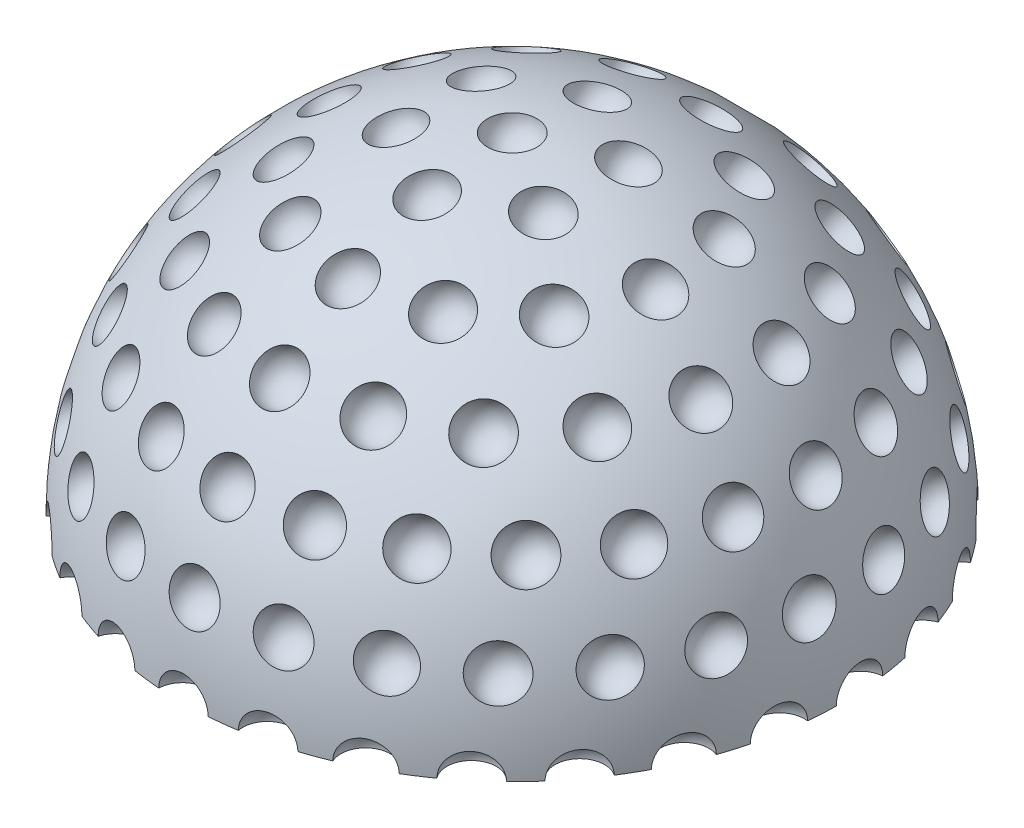
from build123d import *

# Parameters (mm, degrees)
CIRPATTERN1_COUNT       = 2
CIRPATTERN1_ANGLE       = 15
CIRPATTERN2_COUNT       = 2
CIRPATTERN2_ANGLE       = 30
CIRPATTERN3_COUNT       = 2
CIRPATTERN3_ANGLE       = 45
CIRPATTERN4_COUNT       = 2
CIRPATTERN4_ANGLE       = 60
CIRPATTERN5_COUNT       = 2
CIRPATTERN5_ANGLE       = 75
CIRPATTERN6_COUNT       = 2
CIRPATTERN6_ANGLE       = 90
CUT_EXTRUDE1_DEPTH      = 4.318
CUT_EXTRUDE1_DEPTH_BACK = 4.318
SKETCH4_R               = 16.51


with BuildPart() as part:
    # Sketch1 → Revolve1 (revolve)
    with BuildSketch(Plane.XY):
        with BuildLine():
            Line((0, 0), (-50.8, 0))
            ThreePointArc((-50.8, 0), (-35.921024484, 35.921024484), (0, 50.8))
            Line((0, 50.8), (0, 0))
        make_face()
    revolve(axis=Axis((0, 0, 0), (0, 1, 0)))

    # Sketch2 → Cut-Revolve1 (revolve, cut)
    with BuildSketch(Plane.XY):
        with BuildLine():
            Line((0, 54.61), (0, 46.99))
            ThreePointArc((0, 46.99), (3.81, 50.8), (0, 54.61))
        make_face()
    cut_revolve1 = revolve(axis=Axis((0, 54.61, 0), (0, -1, 0)), mode=Mode.SUBTRACT)

    # CirPattern1: Cut-Revolve1 ×2 about axis
    cirpattern1_axis = Axis((-50.679019357, 0, 0), (1, 0, 0))
    for i in range(1, CIRPATTERN1_COUNT):
        add(cut_revolve1.rotate(cirpattern1_axis, i * CIRPATTERN1_ANGLE / (CIRPATTERN1_COUNT - 1)), mode=Mode.SUBTRACT)

    # CirPattern2: Cut-Revolve1 ×2 about axis
    cirpattern2_axis = Axis((-50.679019357, 0, 0), (1, 0, 0))
    for i in range(1, CIRPATTERN2_COUNT):
        add(cut_revolve1.rotate(cirpattern2_axis, i * CIRPATTERN2_ANGLE / (CIRPATTERN2_COUNT - 1)), mode=Mode.SUBTRACT)

    # CirPattern3: Cut-Revolve1 ×2 about axis
    cirpattern3_axis = Axis((-50.679019357, 0, 0), (1, 0, 0))
    for i in range(1, CIRPATTERN3_COUNT):
        add(cut_revolve1.rotate(cirpattern3_axis, i * CIRPATTERN3_ANGLE / (CIRPATTERN3_COUNT - 1)), mode=Mode.SUBTRACT)

    # CirPattern4: Cut-Revolve1 ×2 about axis
    cirpattern4_axis = Axis((-50.679019357, 0, 0), (1, 0, 0))
    for i in range(1, CIRPATTERN4_COUNT):
        add(cut_revolve1.rotate(cirpattern4_axis, i * CIRPATTERN4_ANGLE / (CIRPATTERN4_COUNT - 1)), mode=Mode.SUBTRACT)

    # CirPattern5: Cut-Revolve1 ×2 about axis
    cirpattern5_axis = Axis((-50.679019357, 0, 0), (1, 0, 0))
    for i in range(1, CIRPATTERN5_COUNT):
        add(cut_revolve1.rotate(cirpattern5_axis, i * CIRPATTERN5_ANGLE / (CIRPATTERN5_COUNT - 1)), mode=Mode.SUBTRACT)

    # CirPattern6: Cut-Revolve1 ×2 about axis
    cirpattern6_axis = Axis((-50.679019357, 0, 0), (1, 0, 0))
    for i in range(1, CIRPATTERN6_COUNT):
        add(cut_revolve1.rotate(cirpattern6_axis, i * CIRPATTERN6_ANGLE / (CIRPATTERN6_COUNT - 1)), mode=Mode.SUBTRACT)

    # CirPattern8 copy 1 sketch → CirPattern8 copy 1 (revolve, cut)
    with BuildSketch(Plane(origin=(0, 0, 0), x_dir=(0.5000000000000001, 0, 0.8660254037844386), z_dir=(-0.8365163037378077, -0.2588190451025214, 0.48296291314453416))):
        with BuildLine():
            Line((0, 54.61), (0, 46.99))
            ThreePointArc((0, 46.99), (3.81, 50.8), (0, 54.61))
        make_face()
    revolve(axis=Axis((-12.240496634, 52.749209374, 7.067054027), (0.22414386804201392, -0.9659258262890681, -0.12940952255126073)), mode=Mode.SUBTRACT)

    # CirPattern8 copy 2 sketch → CirPattern8 copy 2 (revolve, cut)
    with BuildSketch(Plane(origin=(0, 0, 0), x_dir=(-0.4999999999999998, 0, 0.8660254037844387), z_dir=(-0.8365163037378078, -0.2588190451025214, -0.4829629131445338))):
        with BuildLine():
            Line((0, 54.61), (0, 46.99))
            ThreePointArc((0, 46.99), (3.81, 50.8), (0, 54.61))
        make_face()
    revolve(axis=Axis((-12.240496634, 52.749209374, -7.067054027), (0.22414386804201394, -0.9659258262890681, 0.12940952255126065)), mode=Mode.SUBTRACT)

    # CirPattern8 copy 3 sketch → CirPattern8 copy 3 (revolve, cut)
    with BuildSketch(Plane(origin=(0, 0, 0), x_dir=(-1, 0, 0), z_dir=(0, -0.2588190451025214, -0.9659258262890681))):
        with BuildLine():
            Line((0, 54.61), (0, 46.99))
            ThreePointArc((0, 46.99), (3.81, 50.8), (0, 54.61))
        make_face()
    revolve(axis=Axis((0, 52.749209374, -14.134108053), (0, -0.9659258262890681, 0.2588190451025214)), mode=Mode.SUBTRACT)

    # CirPattern8 copy 4 sketch → CirPattern8 copy 4 (revolve, cut)
    with BuildSketch(Plane(origin=(0, 0, 0), x_dir=(-0.5000000000000004, 0, -0.8660254037844384), z_dir=(0.8365163037378075, -0.2588190451025214, -0.4829629131445345))):
        with BuildLine():
            Line((0, 54.61), (0, 46.99))
            ThreePointArc((0, 46.99), (3.81, 50.8), (0, 54.61))
        make_face()
    revolve(axis=Axis((12.240496634, 52.749209374, -7.067054027), (-0.22414386804201386, -0.9659258262890681, 0.1294095225512608)), mode=Mode.SUBTRACT)

    # CirPattern8 copy 5 sketch → CirPattern8 copy 5 (revolve, cut)
    with BuildSketch(Plane(origin=(0, 0, 0), x_dir=(0.5000000000000001, 0, -0.8660254037844386), z_dir=(0.8365163037378077, -0.2588190451025214, 0.48296291314453416))):
        with BuildLine():
            Line((0, 54.61), (0, 46.99))
            ThreePointArc((0, 46.99), (3.81, 50.8), (0, 54.61))
        make_face()
    revolve(axis=Axis((12.240496634, 52.749209374, 7.067054027), (-0.22414386804201392, -0.9659258262890681, -0.12940952255126073)), mode=Mode.SUBTRACT)

    # CirPattern8 copy 6 sketch → CirPattern8 copy 6 (revolve, cut)
    with BuildSketch(Plane(origin=(0, 0, 0), x_dir=(0.5000000000000001, 0, 0.8660254037844386), z_dir=(-0.8660254037844386, 0, 0.5000000000000001))):
        with BuildLine():
            Line((0, 54.61), (0, 46.99))
            ThreePointArc((0, 46.99), (3.81, 50.8), (0, 54.61))
        make_face()
    revolve(axis=Axis((0, 54.61, 0), (0, -1, 0)), mode=Mode.SUBTRACT)

    # CirPattern8 copy 7 sketch → CirPattern8 copy 7 (revolve, cut)
    with BuildSketch(Plane(origin=(0, 0, 0), x_dir=(-0.4999999999999998, 0, 0.8660254037844387), z_dir=(-0.8660254037844387, 0, -0.4999999999999998))):
        with BuildLine():
            Line((0, 54.61), (0, 46.99))
            ThreePointArc((0, 46.99), (3.81, 50.8), (0, 54.61))
        make_face()
    revolve(axis=Axis((0, 54.61, 0), (0, -1, 0)), mode=Mode.SUBTRACT)

    # CirPattern8 copy 8 sketch → CirPattern8 copy 8 (revolve, cut)
    with BuildSketch(Plane(origin=(0, 0, 0), x_dir=(-1, 0, 0), z_dir=(0, 0, -1))):
        with BuildLine():
            Line((0, 54.61), (0, 46.99))
            ThreePointArc((0, 46.99), (3.81, 50.8), (0, 54.61))
        make_face()
    revolve(axis=Axis((0, 54.61, 0), (0, -1, 0)), mode=Mode.SUBTRACT)

    # CirPattern8 copy 9 sketch → CirPattern8 copy 9 (revolve, cut)
    with BuildSketch(Plane(origin=(0, 0, 0), x_dir=(-0.5000000000000004, 0, -0.8660254037844384), z_dir=(0.8660254037844384, 0, -0.5000000000000004))):
        with BuildLine():
            Line((0, 54.61), (0, 46.99))
            ThreePointArc((0, 46.99), (3.81, 50.8), (0, 54.61))
        make_face()
    revolve(axis=Axis((0, 54.61, 0), (0, -1, 0)), mode=Mode.SUBTRACT)

    # CirPattern8 copy 10 sketch → CirPattern8 copy 10 (revolve, cut)
    with BuildSketch(Plane(origin=(0, 0, 0), x_dir=(0.5000000000000001, 0, -0.8660254037844386), z_dir=(0.8660254037844386, 0, 0.5000000000000001))):
        with BuildLine():
            Line((0, 54.61), (0, 46.99))
            ThreePointArc((0, 46.99), (3.81, 50.8), (0, 54.61))
        make_face()
    revolve(axis=Axis((0, 54.61, 0), (0, -1, 0)), mode=Mode.SUBTRACT)

    # CirPattern9 copy 1 sketch → CirPattern9 copy 1 (revolve, cut)
    with BuildSketch(Plane(origin=(0, 0, 0), x_dir=(0.8854560256532099, 0, 0.46472317204376856), z_dir=(-0.4024620727171896, -0.5000000000000008, 0.766827412149685))):
        with BuildLine():
            Line((0, 54.61), (0, 46.99))
            ThreePointArc((0, 46.99), (3.81, 50.8), (0, 54.61))
        make_face()
    revolve(axis=Axis((-12.689266213, 47.293647301, 24.17737678), (0.23236158602188464, -0.8660254037844382, -0.4427280128266056)), mode=Mode.SUBTRACT)

    # CirPattern9 copy 2 sketch → CirPattern9 copy 2 (revolve, cut)
    with BuildSketch(Plane(origin=(0, 0, 0), x_dir=(0.5680647467311558, 0, 0.8229838658936565), z_dir=(-0.7127249347686317, -0.5000000000000008, 0.4919585016635538))):
        with BuildLine():
            Line((0, 54.61), (0, 46.99))
            ThreePointArc((0, 46.99), (3.81, 50.8), (0, 54.61))
        make_face()
    revolve(axis=Axis((-22.471574458, 47.293647301, 15.511007909), (0.4114919329468289, -0.8660254037844382, -0.28403237336557835)), mode=Mode.SUBTRACT)

    # CirPattern9 copy 3 sketch → CirPattern9 copy 3 (revolve, cut)
    with BuildSketch(Plane(origin=(0, 0, 0), x_dir=(0.120536680255323, 0, 0.992708874098054), z_dir=(-0.8597111035311622, -0.5000000000000008, 0.10438782718895182))):
        with BuildLine():
            Line((0, 54.61), (0, 46.99))
            ThreePointArc((0, 46.99), (3.81, 50.8), (0, 54.61))
        make_face()
    revolve(axis=Axis((-27.105915807, 47.293647301, 3.291254054), (0.49635443704902776, -0.8660254037844382, -0.0602683401276616)), mode=Mode.SUBTRACT)

    # CirPattern9 copy 4 sketch → CirPattern9 copy 4 (revolve, cut)
    with BuildSketch(Plane(origin=(0, 0, 0), x_dir=(-0.3546048870425357, 0, 0.9350162426854148), z_dir=(-0.8097478191166446, -0.5000000000000007, -0.30709684048494706))):
        with BuildLine():
            Line((0, 54.61), (0, 46.99))
            ThreePointArc((0, 46.99), (3.81, 50.8), (0, 54.61))
        make_face()
    revolve(axis=Axis((-25.530618507, 47.293647301, -9.682486441), (0.46750812134270814, -0.866025403784438, 0.17730244352126812)), mode=Mode.SUBTRACT)

    # CirPattern9 copy 5 sketch → CirPattern9 copy 5 (revolve, cut)
    with BuildSketch(Plane(origin=(0, 0, 0), x_dir=(-0.7485107481711009, 0, 0.6631226582407955), z_dir=(-0.5742810678615949, -0.5000000000000008, -0.6482293229218695))):
        with BuildLine():
            Line((0, 54.61), (0, 46.99))
            ThreePointArc((0, 46.99), (3.81, 50.8), (0, 54.61))
        make_face()
    revolve(axis=Axis((-18.106564183, 47.293647301, -20.438085979), (0.33156132912039826, -0.8660254037844382, 0.374255374085551)), mode=Mode.SUBTRACT)

    # CirPattern9 copy 6 sketch → CirPattern9 copy 6 (revolve, cut)
    with BuildSketch(Plane(origin=(0, 0, 0), x_dir=(-0.970941817426052, 0, 0.23931566428755768), z_dir=(-0.20725344479657318, -0.5000000000000008, -0.8408602794875929))):
        with BuildLine():
            Line((0, 54.61), (0, 46.99))
            ThreePointArc((0, 46.99), (3.81, 50.8), (0, 54.61))
        make_face()
    revolve(axis=Axis((-6.534514213, 47.293647301, -26.511566325), (0.11965783214377902, -0.8660254037844382, 0.4854709087130268)), mode=Mode.SUBTRACT)

    # CirPattern9 copy 7 sketch → CirPattern9 copy 7 (revolve, cut)
    with BuildSketch(Plane(origin=(0, 0, 0), x_dir=(-0.970941817426052, 0, -0.23931566428755788), z_dir=(0.20725344479657334, -0.5000000000000008, -0.8408602794875929))):
        with BuildLine():
            Line((0, 54.61), (0, 46.99))
            ThreePointArc((0, 46.99), (3.81, 50.8), (0, 54.61))
        make_face()
    revolve(axis=Axis((6.534514213, 47.293647301, -26.511566325), (-0.11965783214377912, -0.8660254037844382, 0.4854709087130268)), mode=Mode.SUBTRACT)

    # CirPattern9 copy 8 sketch → CirPattern9 copy 8 (revolve, cut)
    with BuildSketch(Plane(origin=(0, 0, 0), x_dir=(-0.748510748171101, 0, -0.6631226582407953), z_dir=(0.5742810678615947, -0.5000000000000008, -0.6482293229218696))):
        with BuildLine():
            Line((0, 54.61), (0, 46.99))
            ThreePointArc((0, 46.99), (3.81, 50.8), (0, 54.61))
        make_face()
    revolve(axis=Axis((18.106564183, 47.293647301, -20.438085979), (-0.33156132912039815, -0.8660254037844382, 0.37425537408555104)), mode=Mode.SUBTRACT)

    # CirPattern9 copy 9 sketch → CirPattern9 copy 9 (revolve, cut)
    with BuildSketch(Plane(origin=(0, 0, 0), x_dir=(-0.3546048870425359, 0, -0.9350162426854147), z_dir=(0.8097478191166445, -0.5000000000000008, -0.30709684048494723))):
        with BuildLine():
            Line((0, 54.61), (0, 46.99))
            ThreePointArc((0, 46.99), (3.81, 50.8), (0, 54.61))
        make_face()
    revolve(axis=Axis((25.530618507, 47.293647301, -9.682486441), (-0.4675081213427081, -0.8660254037844382, 0.17730244352126823)), mode=Mode.SUBTRACT)

    # CirPattern9 copy 10 sketch → CirPattern9 copy 10 (revolve, cut)
    with BuildSketch(Plane(origin=(0, 0, 0), x_dir=(0.12053668025532233, 0, -0.9927088740980541), z_dir=(0.8597111035311623, -0.5000000000000008, 0.10438782718895123))):
        with BuildLine():
            Line((0, 54.61), (0, 46.99))
            ThreePointArc((0, 46.99), (3.81, 50.8), (0, 54.61))
        make_face()
    revolve(axis=Axis((27.105915807, 47.293647301, 3.291254054), (-0.4963544370490278, -0.8660254037844382, -0.06026834012766126)), mode=Mode.SUBTRACT)

    # CirPattern9 copy 11 sketch → CirPattern9 copy 11 (revolve, cut)
    with BuildSketch(Plane(origin=(0, 0, 0), x_dir=(0.5680647467311563, 0, -0.822983865893656), z_dir=(0.7127249347686313, -0.5000000000000008, 0.4919585016635542))):
        with BuildLine():
            Line((0, 54.61), (0, 46.99))
            ThreePointArc((0, 46.99), (3.81, 50.8), (0, 54.61))
        make_face()
    revolve(axis=Axis((22.471574458, 47.293647301, 15.511007909), (-0.4114919329468287, -0.8660254037844382, -0.28403237336557857)), mode=Mode.SUBTRACT)

    # CirPattern9 copy 12 sketch → CirPattern9 copy 12 (revolve, cut)
    with BuildSketch(Plane(origin=(0, 0, 0), x_dir=(0.88545602565321, 0, -0.4647231720437684), z_dir=(0.4024620727171894, -0.5000000000000008, 0.7668274121496851))):
        with BuildLine():
            Line((0, 54.61), (0, 46.99))
            ThreePointArc((0, 46.99), (3.81, 50.8), (0, 54.61))
        make_face()
    revolve(axis=Axis((12.689266213, 47.293647301, 24.17737678), (-0.23236158602188456, -0.8660254037844382, -0.4427280128266057)), mode=Mode.SUBTRACT)

    # CirPattern9 copy 13 sketch → CirPattern9 copy 13 (revolve, cut)
    with BuildSketch(Plane(origin=(0, 0, 0), x_dir=(0.8854560256532099, 0, 0.46472317204376856), z_dir=(-0.46472317204376856, 0, 0.8854560256532099))):
        with BuildLine():
            Line((0, 54.61), (0, 46.99))
            ThreePointArc((0, 46.99), (3.81, 50.8), (0, 54.61))
        make_face()
    revolve(axis=Axis((0, 54.61, 0), (0, -1, 0)), mode=Mode.SUBTRACT)

    # CirPattern9 copy 14 sketch → CirPattern9 copy 14 (revolve, cut)
    with BuildSketch(Plane(origin=(0, 0, 0), x_dir=(0.5680647467311558, 0, 0.8229838658936565), z_dir=(-0.8229838658936565, 0, 0.5680647467311558))):
        with BuildLine():
            Line((0, 54.61), (0, 46.99))
            ThreePointArc((0, 46.99), (3.81, 50.8), (0, 54.61))
        make_face()
    revolve(axis=Axis((0, 54.61, 0), (0, -1, 0)), mode=Mode.SUBTRACT)

    # CirPattern9 copy 15 sketch → CirPattern9 copy 15 (revolve, cut)
    with BuildSketch(Plane(origin=(0, 0, 0), x_dir=(0.120536680255323, 0, 0.992708874098054), z_dir=(-0.992708874098054, 0, 0.120536680255323))):
        with BuildLine():
            Line((0, 54.61), (0, 46.99))
            ThreePointArc((0, 46.99), (3.81, 50.8), (0, 54.61))
        make_face()
    revolve(axis=Axis((0, 54.61, 0), (0, -1, 0)), mode=Mode.SUBTRACT)

    # CirPattern9 copy 16 sketch → CirPattern9 copy 16 (revolve, cut)
    with BuildSketch(Plane(origin=(0, 0, 0), x_dir=(-0.3546048870425357, 0, 0.9350162426854148), z_dir=(-0.9350162426854148, 0, -0.3546048870425357))):
        with BuildLine():
            Line((0, 54.61), (0, 46.99))
            ThreePointArc((0, 46.99), (3.81, 50.8), (0, 54.61))
        make_face()
    revolve(axis=Axis((0, 54.61, 0), (0, -1, 0)), mode=Mode.SUBTRACT)

    # CirPattern9 copy 17 sketch → CirPattern9 copy 17 (revolve, cut)
    with BuildSketch(Plane(origin=(0, 0, 0), x_dir=(-0.7485107481711009, 0, 0.6631226582407955), z_dir=(-0.6631226582407955, 0, -0.7485107481711009))):
        with BuildLine():
            Line((0, 54.61), (0, 46.99))
            ThreePointArc((0, 46.99), (3.81, 50.8), (0, 54.61))
        make_face()
    revolve(axis=Axis((0, 54.61, 0), (0, -1, 0)), mode=Mode.SUBTRACT)

    # CirPattern9 copy 18 sketch → CirPattern9 copy 18 (revolve, cut)
    with BuildSketch(Plane(origin=(0, 0, 0), x_dir=(-0.970941817426052, 0, 0.23931566428755768), z_dir=(-0.23931566428755768, 0, -0.970941817426052))):
        with BuildLine():
            Line((0, 54.61), (0, 46.99))
            ThreePointArc((0, 46.99), (3.81, 50.8), (0, 54.61))
        make_face()
    revolve(axis=Axis((0, 54.61, 0), (0, -1, 0)), mode=Mode.SUBTRACT)

    # CirPattern9 copy 19 sketch → CirPattern9 copy 19 (revolve, cut)
    with BuildSketch(Plane(origin=(0, 0, 0), x_dir=(-0.970941817426052, 0, -0.23931566428755788), z_dir=(0.23931566428755788, 0, -0.970941817426052))):
        with BuildLine():
            Line((0, 54.61), (0, 46.99))
            ThreePointArc((0, 46.99), (3.81, 50.8), (0, 54.61))
        make_face()
    revolve(axis=Axis((0, 54.61, 0), (0, -1, 0)), mode=Mode.SUBTRACT)

    # CirPattern9 copy 20 sketch → CirPattern9 copy 20 (revolve, cut)
    with BuildSketch(Plane(origin=(0, 0, 0), x_dir=(-0.748510748171101, 0, -0.6631226582407953), z_dir=(0.6631226582407953, 0, -0.748510748171101))):
        with BuildLine():
            Line((0, 54.61), (0, 46.99))
            ThreePointArc((0, 46.99), (3.81, 50.8), (0, 54.61))
        make_face()
    revolve(axis=Axis((0, 54.61, 0), (0, -1, 0)), mode=Mode.SUBTRACT)

    # CirPattern9 copy 21 sketch → CirPattern9 copy 21 (revolve, cut)
    with BuildSketch(Plane(origin=(0, 0, 0), x_dir=(-0.3546048870425359, 0, -0.9350162426854147), z_dir=(0.9350162426854147, 0, -0.3546048870425359))):
        with BuildLine():
            Line((0, 54.61), (0, 46.99))
            ThreePointArc((0, 46.99), (3.81, 50.8), (0, 54.61))
        make_face()
    revolve(axis=Axis((0, 54.61, 0), (0, -1, 0)), mode=Mode.SUBTRACT)

    # CirPattern9 copy 22 sketch → CirPattern9 copy 22 (revolve, cut)
    with BuildSketch(Plane(origin=(0, 0, 0), x_dir=(0.12053668025532233, 0, -0.9927088740980541), z_dir=(0.9927088740980541, 0, 0.12053668025532233))):
        with BuildLine():
            Line((0, 54.61), (0, 46.99))
            ThreePointArc((0, 46.99), (3.81, 50.8), (0, 54.61))
        make_face()
    revolve(axis=Axis((0, 54.61, 0), (0, -1, 0)), mode=Mode.SUBTRACT)

    # CirPattern9 copy 23 sketch → CirPattern9 copy 23 (revolve, cut)
    with BuildSketch(Plane(origin=(0, 0, 0), x_dir=(0.5680647467311563, 0, -0.822983865893656), z_dir=(0.822983865893656, 0, 0.5680647467311563))):
        with BuildLine():
            Line((0, 54.61), (0, 46.99))
            ThreePointArc((0, 46.99), (3.81, 50.8), (0, 54.61))
        make_face()
    revolve(axis=Axis((0, 54.61, 0), (0, -1, 0)), mode=Mode.SUBTRACT)

    # CirPattern9 copy 24 sketch → CirPattern9 copy 24 (revolve, cut)
    with BuildSketch(Plane(origin=(0, 0, 0), x_dir=(0.88545602565321, 0, -0.4647231720437684), z_dir=(0.4647231720437684, 0, 0.88545602565321))):
        with BuildLine():
            Line((0, 54.61), (0, 46.99))
            ThreePointArc((0, 46.99), (3.81, 50.8), (0, 54.61))
        make_face()
    revolve(axis=Axis((0, 54.61, 0), (0, -1, 0)), mode=Mode.SUBTRACT)

    # CirPattern10 copy 1 sketch → CirPattern10 copy 1 (revolve, cut)
    with BuildSketch(Plane(origin=(0, 0, 0), x_dir=(0.9396926207859084, 0, 0.3420201433256687), z_dir=(-0.2418447626479748, -0.7071067811865488, 0.6644630243886736))):
        with BuildLine():
            Line((0, 54.61), (0, 46.99))
            ThreePointArc((0, 46.99), (3.81, 50.8), (0, 54.61))
        make_face()
    revolve(axis=Axis((-13.207142488, 38.615101321, 36.286325762), (0.2418447626479757, -0.7071067811865462, -0.6644630243886759)), mode=Mode.SUBTRACT)

    # CirPattern10 copy 2 sketch → CirPattern10 copy 2 (revolve, cut)
    with BuildSketch(Plane(origin=(0, 0, 0), x_dir=(0.766044443118978, 0, 0.6427876096865393), z_dir=(-0.4545194776720428, -0.7071067811865488, 0.5416752204197008))):
        with BuildLine():
            Line((0, 54.61), (0, 46.99))
            ThreePointArc((0, 46.99), (3.81, 50.8), (0, 54.61))
        make_face()
    revolve(axis=Axis((-24.821308676, 38.615101321, 29.580883787), (0.4545194776720444, -0.7071067811865462, -0.5416752204197028)), mode=Mode.SUBTRACT)

    # CirPattern10 copy 3 sketch → CirPattern10 copy 3 (revolve, cut)
    with BuildSketch(Plane(origin=(0, 0, 0), x_dir=(0.5000000000000001, 0, 0.8660254037844386), z_dir=(-0.6123724356957934, -0.7071067811865488, 0.3535533905932732))):
        with BuildLine():
            Line((0, 54.61), (0, 46.99))
            ThreePointArc((0, 46.99), (3.81, 50.8), (0, 54.61))
        make_face()
    revolve(axis=Axis((-33.441658713, 38.615101321, 19.30755066), (0.6123724356957956, -0.7071067811865462, -0.35355339059327445)), mode=Mode.SUBTRACT)

    # CirPattern10 copy 4 sketch → CirPattern10 copy 4 (revolve, cut)
    with BuildSketch(Plane(origin=(0, 0, 0), x_dir=(0.17364817766693041, 0, 0.984807753012208), z_dir=(-0.6963642403200176, -0.7071067811865488, 0.12278780396897267))):
        with BuildLine():
            Line((0, 54.61), (0, 46.99))
            ThreePointArc((0, 46.99), (3.81, 50.8), (0, 54.61))
        make_face()
    revolve(axis=Axis((-38.028451164, 38.615101321, 6.705441975), (0.6963642403200202, -0.7071067811865462, -0.12278780396897311)), mode=Mode.SUBTRACT)

    # CirPattern10 copy 5 sketch → CirPattern10 copy 5 (revolve, cut)
    with BuildSketch(Plane(origin=(0, 0, 0), x_dir=(-0.1736481776669303, 0, 0.984807753012208), z_dir=(-0.6963642403200176, -0.7071067811865488, -0.1227878039689726))):
        with BuildLine():
            Line((0, 54.61), (0, 46.99))
            ThreePointArc((0, 46.99), (3.81, 50.8), (0, 54.61))
        make_face()
    revolve(axis=Axis((-38.028451164, 38.615101321, -6.705441975), (0.6963642403200202, -0.7071067811865462, 0.12278780396897304)), mode=Mode.SUBTRACT)

    # CirPattern10 copy 6 sketch → CirPattern10 copy 6 (revolve, cut)
    with BuildSketch(Plane(origin=(0, 0, 0), x_dir=(-0.4999999999999998, 0, 0.8660254037844387), z_dir=(-0.6123724356957935, -0.7071067811865488, -0.35355339059327295))):
        with BuildLine():
            Line((0, 54.61), (0, 46.99))
            ThreePointArc((0, 46.99), (3.81, 50.8), (0, 54.61))
        make_face()
    revolve(axis=Axis((-33.441658713, 38.615101321, -19.30755066), (0.6123724356957957, -0.7071067811865462, 0.35355339059327423)), mode=Mode.SUBTRACT)

    # CirPattern10 copy 7 sketch → CirPattern10 copy 7 (revolve, cut)
    with BuildSketch(Plane(origin=(0, 0, 0), x_dir=(-0.7660444431189779, 0, 0.6427876096865395), z_dir=(-0.454519477672043, -0.7071067811865488, -0.5416752204197007))):
        with BuildLine():
            Line((0, 54.61), (0, 46.99))
            ThreePointArc((0, 46.99), (3.81, 50.8), (0, 54.61))
        make_face()
    revolve(axis=Axis((-24.821308676, 38.615101321, -29.580883787), (0.4545194776720446, -0.7071067811865462, 0.5416752204197027)), mode=Mode.SUBTRACT)

    # CirPattern10 copy 8 sketch → CirPattern10 copy 8 (revolve, cut)
    with BuildSketch(Plane(origin=(0, 0, 0), x_dir=(-0.9396926207859083, 0, 0.3420201433256689), z_dir=(-0.24184476264797491, -0.7071067811865488, -0.6644630243886734))):
        with BuildLine():
            Line((0, 54.61), (0, 46.99))
            ThreePointArc((0, 46.99), (3.81, 50.8), (0, 54.61))
        make_face()
    revolve(axis=Axis((-13.207142488, 38.615101321, -36.286325762), (0.2418447626479758, -0.7071067811865462, 0.6644630243886759)), mode=Mode.SUBTRACT)

    # CirPattern10 copy 9 sketch → CirPattern10 copy 9 (revolve, cut)
    with BuildSketch(Plane(origin=(0, 0, 0), x_dir=(-1, 0, 0), z_dir=(0, -0.7071067811865488, -0.7071067811865462))):
        with BuildLine():
            Line((0, 54.61), (0, 46.99))
            ThreePointArc((0, 46.99), (3.81, 50.8), (0, 54.61))
        make_face()
    revolve(axis=Axis((0, 38.615101321, -38.615101321), (0, -0.7071067811865462, 0.7071067811865488)), mode=Mode.SUBTRACT)

    # CirPattern10 copy 10 sketch → CirPattern10 copy 10 (revolve, cut)
    with BuildSketch(Plane(origin=(0, 0, 0), x_dir=(-0.9396926207859084, 0, -0.34202014332566866), z_dir=(0.24184476264797478, -0.7071067811865488, -0.6644630243886736))):
        with BuildLine():
            Line((0, 54.61), (0, 46.99))
            ThreePointArc((0, 46.99), (3.81, 50.8), (0, 54.61))
        make_face()
    revolve(axis=Axis((13.207142488, 38.615101321, -36.286325762), (-0.24184476264797564, -0.7071067811865462, 0.6644630243886759)), mode=Mode.SUBTRACT)

    # CirPattern10 copy 11 sketch → CirPattern10 copy 11 (revolve, cut)
    with BuildSketch(Plane(origin=(0, 0, 0), x_dir=(-0.766044443118978, 0, -0.6427876096865393), z_dir=(0.4545194776720428, -0.7071067811865487, -0.5416752204197008))):
        with BuildLine():
            Line((0, 54.61), (0, 46.99))
            ThreePointArc((0, 46.99), (3.81, 50.8), (0, 54.61))
        make_face()
    revolve(axis=Axis((24.821308676, 38.615101321, -29.580883787), (-0.4545194776720444, -0.7071067811865461, 0.5416752204197028)), mode=Mode.SUBTRACT)

    # CirPattern10 copy 12 sketch → CirPattern10 copy 12 (revolve, cut)
    with BuildSketch(Plane(origin=(0, 0, 0), x_dir=(-0.5000000000000004, 0, -0.8660254037844384), z_dir=(0.6123724356957932, -0.7071067811865488, -0.35355339059327345))):
        with BuildLine():
            Line((0, 54.61), (0, 46.99))
            ThreePointArc((0, 46.99), (3.81, 50.8), (0, 54.61))
        make_face()
    revolve(axis=Axis((33.441658713, 38.615101321, -19.30755066), (-0.6123724356957955, -0.7071067811865462, 0.35355339059327473)), mode=Mode.SUBTRACT)

    # CirPattern10 copy 13 sketch → CirPattern10 copy 13 (revolve, cut)
    with BuildSketch(Plane(origin=(0, 0, 0), x_dir=(-0.17364817766693033, 0, -0.984807753012208), z_dir=(0.6963642403200176, -0.7071067811865488, -0.12278780396897261))):
        with BuildLine():
            Line((0, 54.61), (0, 46.99))
            ThreePointArc((0, 46.99), (3.81, 50.8), (0, 54.61))
        make_face()
    revolve(axis=Axis((38.028451164, 38.615101321, -6.705441975), (-0.6963642403200202, -0.7071067811865462, 0.12278780396897306)), mode=Mode.SUBTRACT)

    # CirPattern10 copy 14 sketch → CirPattern10 copy 14 (revolve, cut)
    with BuildSketch(Plane(origin=(0, 0, 0), x_dir=(0.17364817766692997, 0, -0.9848077530122081), z_dir=(0.6963642403200178, -0.7071067811865488, 0.12278780396897236))):
        with BuildLine():
            Line((0, 54.61), (0, 46.99))
            ThreePointArc((0, 46.99), (3.81, 50.8), (0, 54.61))
        make_face()
    revolve(axis=Axis((38.028451164, 38.615101321, 6.705441975), (-0.6963642403200202, -0.7071067811865462, -0.1227878039689728)), mode=Mode.SUBTRACT)

    # CirPattern10 copy 15 sketch → CirPattern10 copy 15 (revolve, cut)
    with BuildSketch(Plane(origin=(0, 0, 0), x_dir=(0.5000000000000001, 0, -0.8660254037844386), z_dir=(0.6123724356957934, -0.7071067811865488, 0.3535533905932732))):
        with BuildLine():
            Line((0, 54.61), (0, 46.99))
            ThreePointArc((0, 46.99), (3.81, 50.8), (0, 54.61))
        make_face()
    revolve(axis=Axis((33.441658713, 38.615101321, 19.30755066), (-0.6123724356957956, -0.7071067811865462, -0.35355339059327445)), mode=Mode.SUBTRACT)

    # CirPattern10 copy 16 sketch → CirPattern10 copy 16 (revolve, cut)
    with BuildSketch(Plane(origin=(0, 0, 0), x_dir=(0.7660444431189778, 0, -0.6427876096865396), z_dir=(0.45451947767204304, -0.7071067811865488, 0.5416752204197007))):
        with BuildLine():
            Line((0, 54.61), (0, 46.99))
            ThreePointArc((0, 46.99), (3.81, 50.8), (0, 54.61))
        make_face()
    revolve(axis=Axis((24.821308676, 38.615101321, 29.580883787), (-0.4545194776720447, -0.7071067811865462, -0.5416752204197026)), mode=Mode.SUBTRACT)

    # CirPattern10 copy 17 sketch → CirPattern10 copy 17 (revolve, cut)
    with BuildSketch(Plane(origin=(0, 0, 0), x_dir=(0.9396926207859084, 0, -0.3420201433256686), z_dir=(0.24184476264797472, -0.7071067811865488, 0.6644630243886736))):
        with BuildLine():
            Line((0, 54.61), (0, 46.99))
            ThreePointArc((0, 46.99), (3.81, 50.8), (0, 54.61))
        make_face()
    revolve(axis=Axis((13.207142488, 38.615101321, 36.286325762), (-0.2418447626479756, -0.7071067811865462, -0.6644630243886759)), mode=Mode.SUBTRACT)

    # CirPattern10 copy 18 sketch → CirPattern10 copy 18 (revolve, cut)
    with BuildSketch(Plane(origin=(0, 0, 0), x_dir=(0.9396926207859084, 0, 0.3420201433256687), z_dir=(-0.3420201433256687, 0, 0.9396926207859084))):
        with BuildLine():
            Line((0, 54.61), (0, 46.99))
            ThreePointArc((0, 46.99), (3.81, 50.8), (0, 54.61))
        make_face()
    revolve(axis=Axis((0, 54.61, 0), (0, -1, 0)), mode=Mode.SUBTRACT)

    # CirPattern10 copy 19 sketch → CirPattern10 copy 19 (revolve, cut)
    with BuildSketch(Plane(origin=(0, 0, 0), x_dir=(0.766044443118978, 0, 0.6427876096865393), z_dir=(-0.6427876096865393, 0, 0.766044443118978))):
        with BuildLine():
            Line((0, 54.61), (0, 46.99))
            ThreePointArc((0, 46.99), (3.81, 50.8), (0, 54.61))
        make_face()
    revolve(axis=Axis((0, 54.61, 0), (0, -1, 0)), mode=Mode.SUBTRACT)

    # CirPattern10 copy 20 sketch → CirPattern10 copy 20 (revolve, cut)
    with BuildSketch(Plane(origin=(0, 0, 0), x_dir=(0.5000000000000001, 0, 0.8660254037844386), z_dir=(-0.8660254037844386, 0, 0.5000000000000001))):
        with BuildLine():
            Line((0, 54.61), (0, 46.99))
            ThreePointArc((0, 46.99), (3.81, 50.8), (0, 54.61))
        make_face()
    revolve(axis=Axis((0, 54.61, 0), (0, -1, 0)), mode=Mode.SUBTRACT)

    # CirPattern10 copy 21 sketch → CirPattern10 copy 21 (revolve, cut)
    with BuildSketch(Plane(origin=(0, 0, 0), x_dir=(0.17364817766693041, 0, 0.984807753012208), z_dir=(-0.984807753012208, 0, 0.17364817766693041))):
        with BuildLine():
            Line((0, 54.61), (0, 46.99))
            ThreePointArc((0, 46.99), (3.81, 50.8), (0, 54.61))
        make_face()
    revolve(axis=Axis((0, 54.61, 0), (0, -1, 0)), mode=Mode.SUBTRACT)

    # CirPattern10 copy 22 sketch → CirPattern10 copy 22 (revolve, cut)
    with BuildSketch(Plane(origin=(0, 0, 0), x_dir=(-0.1736481776669303, 0, 0.984807753012208), z_dir=(-0.984807753012208, 0, -0.1736481776669303))):
        with BuildLine():
            Line((0, 54.61), (0, 46.99))
            ThreePointArc((0, 46.99), (3.81, 50.8), (0, 54.61))
        make_face()
    revolve(axis=Axis((0, 54.61, 0), (0, -1, 0)), mode=Mode.SUBTRACT)

    # CirPattern10 copy 23 sketch → CirPattern10 copy 23 (revolve, cut)
    with BuildSketch(Plane(origin=(0, 0, 0), x_dir=(-0.4999999999999998, 0, 0.8660254037844387), z_dir=(-0.8660254037844387, 0, -0.4999999999999998))):
        with BuildLine():
            Line((0, 54.61), (0, 46.99))
            ThreePointArc((0, 46.99), (3.81, 50.8), (0, 54.61))
        make_face()
    revolve(axis=Axis((0, 54.61, 0), (0, -1, 0)), mode=Mode.SUBTRACT)

    # CirPattern10 copy 24 sketch → CirPattern10 copy 24 (revolve, cut)
    with BuildSketch(Plane(origin=(0, 0, 0), x_dir=(-0.7660444431189779, 0, 0.6427876096865395), z_dir=(-0.6427876096865395, 0, -0.7660444431189779))):
        with BuildLine():
            Line((0, 54.61), (0, 46.99))
            ThreePointArc((0, 46.99), (3.81, 50.8), (0, 54.61))
        make_face()
    revolve(axis=Axis((0, 54.61, 0), (0, -1, 0)), mode=Mode.SUBTRACT)

    # CirPattern10 copy 25 sketch → CirPattern10 copy 25 (revolve, cut)
    with BuildSketch(Plane(origin=(0, 0, 0), x_dir=(-0.9396926207859083, 0, 0.3420201433256689), z_dir=(-0.3420201433256689, 0, -0.9396926207859083))):
        with BuildLine():
            Line((0, 54.61), (0, 46.99))
            ThreePointArc((0, 46.99), (3.81, 50.8), (0, 54.61))
        make_face()
    revolve(axis=Axis((0, 54.61, 0), (0, -1, 0)), mode=Mode.SUBTRACT)

    # CirPattern10 copy 26 sketch → CirPattern10 copy 26 (revolve, cut)
    with BuildSketch(Plane(origin=(0, 0, 0), x_dir=(-1, 0, 0), z_dir=(0, 0, -1))):
        with BuildLine():
            Line((0, 54.61), (0, 46.99))
            ThreePointArc((0, 46.99), (3.81, 50.8), (0, 54.61))
        make_face()
    revolve(axis=Axis((0, 54.61, 0), (0, -1, 0)), mode=Mode.SUBTRACT)

    # CirPattern10 copy 27 sketch → CirPattern10 copy 27 (revolve, cut)
    with BuildSketch(Plane(origin=(0, 0, 0), x_dir=(-0.9396926207859084, 0, -0.34202014332566866), z_dir=(0.34202014332566866, 0, -0.9396926207859084))):
        with BuildLine():
            Line((0, 54.61), (0, 46.99))
            ThreePointArc((0, 46.99), (3.81, 50.8), (0, 54.61))
        make_face()
    revolve(axis=Axis((0, 54.61, 0), (0, -1, 0)), mode=Mode.SUBTRACT)

    # CirPattern10 copy 28 sketch → CirPattern10 copy 28 (revolve, cut)
    with BuildSketch(Plane(origin=(0, 0, 0), x_dir=(-0.766044443118978, 0, -0.6427876096865393), z_dir=(0.6427876096865393, 0, -0.766044443118978))):
        with BuildLine():
            Line((0, 54.61), (0, 46.99))
            ThreePointArc((0, 46.99), (3.81, 50.8), (0, 54.61))
        make_face()
    revolve(axis=Axis((0, 54.61, 0), (0, -1, 0)), mode=Mode.SUBTRACT)

    # CirPattern10 copy 29 sketch → CirPattern10 copy 29 (revolve, cut)
    with BuildSketch(Plane(origin=(0, 0, 0), x_dir=(-0.5000000000000004, 0, -0.8660254037844384), z_dir=(0.8660254037844384, 0, -0.5000000000000004))):
        with BuildLine():
            Line((0, 54.61), (0, 46.99))
            ThreePointArc((0, 46.99), (3.81, 50.8), (0, 54.61))
        make_face()
    revolve(axis=Axis((0, 54.61, 0), (0, -1, 0)), mode=Mode.SUBTRACT)

    # CirPattern10 copy 30 sketch → CirPattern10 copy 30 (revolve, cut)
    with BuildSketch(Plane(origin=(0, 0, 0), x_dir=(-0.17364817766693033, 0, -0.984807753012208), z_dir=(0.984807753012208, 0, -0.17364817766693033))):
        with BuildLine():
            Line((0, 54.61), (0, 46.99))
            ThreePointArc((0, 46.99), (3.81, 50.8), (0, 54.61))
        make_face()
    revolve(axis=Axis((0, 54.61, 0), (0, -1, 0)), mode=Mode.SUBTRACT)

    # CirPattern10 copy 31 sketch → CirPattern10 copy 31 (revolve, cut)
    with BuildSketch(Plane(origin=(0, 0, 0), x_dir=(0.17364817766692997, 0, -0.9848077530122081), z_dir=(0.9848077530122081, 0, 0.17364817766692997))):
        with BuildLine():
            Line((0, 54.61), (0, 46.99))
            ThreePointArc((0, 46.99), (3.81, 50.8), (0, 54.61))
        make_face()
    revolve(axis=Axis((0, 54.61, 0), (0, -1, 0)), mode=Mode.SUBTRACT)

    # CirPattern10 copy 32 sketch → CirPattern10 copy 32 (revolve, cut)
    with BuildSketch(Plane(origin=(0, 0, 0), x_dir=(0.5000000000000001, 0, -0.8660254037844386), z_dir=(0.8660254037844386, 0, 0.5000000000000001))):
        with BuildLine():
            Line((0, 54.61), (0, 46.99))
            ThreePointArc((0, 46.99), (3.81, 50.8), (0, 54.61))
        make_face()
    revolve(axis=Axis((0, 54.61, 0), (0, -1, 0)), mode=Mode.SUBTRACT)

    # CirPattern10 copy 33 sketch → CirPattern10 copy 33 (revolve, cut)
    with BuildSketch(Plane(origin=(0, 0, 0), x_dir=(0.7660444431189778, 0, -0.6427876096865396), z_dir=(0.6427876096865396, 0, 0.7660444431189778))):
        with BuildLine():
            Line((0, 54.61), (0, 46.99))
            ThreePointArc((0, 46.99), (3.81, 50.8), (0, 54.61))
        make_face()
    revolve(axis=Axis((0, 54.61, 0), (0, -1, 0)), mode=Mode.SUBTRACT)

    # CirPattern10 copy 34 sketch → CirPattern10 copy 34 (revolve, cut)
    with BuildSketch(Plane(origin=(0, 0, 0), x_dir=(0.9396926207859084, 0, -0.3420201433256686), z_dir=(0.3420201433256686, 0, 0.9396926207859084))):
        with BuildLine():
            Line((0, 54.61), (0, 46.99))
            ThreePointArc((0, 46.99), (3.81, 50.8), (0, 54.61))
        make_face()
    revolve(axis=Axis((0, 54.61, 0), (0, -1, 0)), mode=Mode.SUBTRACT)

    # CirPattern11 copy 1 sketch → CirPattern11 copy 1 (revolve, cut)
    with BuildSketch(Plane(origin=(0, 0, 0), x_dir=(0.9629172873477992, 0, 0.2697967711570243), z_dir=(-0.13489838557851153, -0.8660254037844399, 0.48145864367389746))):
        with BuildLine():
            Line((0, 54.61), (0, 46.99))
            ThreePointArc((0, 46.99), (3.81, 50.8), (0, 54.61))
        make_face()
    revolve(axis=Axis((-12.759673338, 27.305, 45.539870568), (0.23365085768100008, -0.4999999999999978, -0.8339108325863954)), mode=Mode.SUBTRACT)

    # CirPattern11 copy 2 sketch → CirPattern11 copy 2 (revolve, cut)
    with BuildSketch(Plane(origin=(0, 0, 0), x_dir=(0.8544194045464886, 0, 0.5195839500354336), z_dir=(-0.2597919750177156, -0.8660254037844399, 0.4272097022732424))):
        with BuildLine():
            Line((0, 54.61), (0, 46.99))
            ThreePointArc((0, 46.99), (3.81, 50.8), (0, 54.61))
        make_face()
    revolve(axis=Axis((-24.573020076, 27.305, 40.408609965), (0.4499729001293506, -0.4999999999999978, -0.7399489098236335)), mode=Mode.SUBTRACT)

    # CirPattern11 copy 3 sketch → CirPattern11 copy 3 (revolve, cut)
    with BuildSketch(Plane(origin=(0, 0, 0), x_dir=(0.682553143218654, 0, 0.7308359642781241), z_dir=(-0.36541798213906046, -0.8660254037844399, 0.3412765716093255))):
        with BuildLine():
            Line((0, 54.61), (0, 46.99))
            ThreePointArc((0, 46.99), (3.81, 50.8), (0, 54.61))
        make_face()
    revolve(axis=Axis((-34.563898329, 27.305, 32.280427619), (0.632922511064153, -0.4999999999999978, -0.5911083614602735)), mode=Mode.SUBTRACT)

    # CirPattern11 copy 4 sketch → CirPattern11 copy 4 (revolve, cut)
    with BuildSketch(Plane(origin=(0, 0, 0), x_dir=(0.4600650377311522, 0, 0.8878852184023752), z_dir=(-0.4439426092011856, -0.8660254037844399, 0.23003251886557508))):
        with BuildLine():
            Line((0, 54.61), (0, 46.99))
            ThreePointArc((0, 46.99), (3.81, 50.8), (0, 54.61))
        make_face()
    revolve(axis=Axis((-41.991330363, 27.305, 21.75815363), (0.7689311547811526, -0.4999999999999978, -0.3984280100682247)), mode=Mode.SUBTRACT)

    # CirPattern11 copy 5 sketch → CirPattern11 copy 5 (revolve, cut)
    with BuildSketch(Plane(origin=(0, 0, 0), x_dir=(0.20345601305263375, 0, 0.9790840876823229), z_dir=(-0.4895420438411593, -0.8660254037844399, 0.10172800652631642))):
        with BuildLine():
            Line((0, 54.61), (0, 46.99))
            ThreePointArc((0, 46.99), (3.81, 50.8), (0, 54.61))
        make_face()
    revolve(axis=Axis((-46.304457521, 27.305, 9.622176923), (0.8479116923740037, -0.4999999999999978, -0.17619807585627942)), mode=Mode.SUBTRACT)

    # CirPattern11 copy 6 sketch → CirPattern11 copy 6 (revolve, cut)
    with BuildSketch(Plane(origin=(0, 0, 0), x_dir=(-0.0682424133646711, 0, 0.9976687691905392), z_dir=(-0.49883438459526735, -0.8660254037844399, -0.0341212066823354))):
        with BuildLine():
            Line((0, 54.61), (0, 46.99))
            ThreePointArc((0, 46.99), (3.81, 50.8), (0, 54.61))
        make_face()
    revolve(axis=Axis((-47.183394893, 27.305, -3.227432629), (0.8640064986813619, -0.4999999999999978, 0.05909966358936395)), mode=Mode.SUBTRACT)

    # CirPattern11 copy 7 sketch → CirPattern11 copy 7 (revolve, cut)
    with BuildSketch(Plane(origin=(0, 0, 0), x_dir=(-0.33487961217098616, 0, 0.9422609221188205), z_dir=(-0.47113046105940815, -0.8660254037844399, -0.16743980608549233))):
        with BuildLine():
            Line((0, 54.61), (0, 46.99))
            ThreePointArc((0, 46.99), (3.81, 50.8), (0, 54.61))
        make_face()
    revolve(axis=Axis((-44.562955716, 27.305, -15.837678266), (0.8160218955482502, -0.4999999999999978, 0.29001425134955494)), mode=Mode.SUBTRACT)

    # CirPattern11 copy 8 sketch → CirPattern11 copy 8 (revolve, cut)
    with BuildSketch(Plane(origin=(0, 0, 0), x_dir=(-0.5766803221148671, 0, 0.8169698930104421), z_dir=(-0.4084849465052192, -0.8660254037844399, -0.28834016105743226))):
        with BuildLine():
            Line((0, 54.61), (0, 46.99))
            ThreePointArc((0, 46.99), (3.81, 50.8), (0, 54.61))
        make_face()
    revolve(axis=Axis((-38.637485975, 27.305, -27.273315759), (0.7075166814740989, -0.4999999999999978, 0.49941980881406867)), mode=Mode.SUBTRACT)

    # CirPattern11 copy 9 sketch → CirPattern11 copy 9 (revolve, cut)
    with BuildSketch(Plane(origin=(0, 0, 0), x_dir=(-0.7757112907044199, 0, 0.6310879443260526), z_dir=(-0.31554397216302493, -0.8660254037844399, -0.38785564535220823))):
        with BuildLine():
            Line((0, 54.61), (0, 46.99))
            ThreePointArc((0, 46.99), (3.81, 50.8), (0, 54.61))
        make_face()
    revolve(axis=Axis((-29.846450655, 27.305, -36.68621619), (0.5465381918084619, -0.4999999999999978, 0.6717856837524443)), mode=Mode.SUBTRACT)

    # CirPattern11 copy 10 sketch → CirPattern11 copy 10 (revolve, cut)
    with BuildSketch(Plane(origin=(0, 0, 0), x_dir=(-0.917211301505453, 0, 0.3984010898462414), z_dir=(-0.1992005449231198, -0.8660254037844399, -0.45860565075272447))):
        with BuildLine():
            Line((0, 54.61), (0, 46.99))
            ThreePointArc((0, 46.99), (3.81, 50.8), (0, 54.61))
        make_face()
    revolve(axis=Axis((-18.841840627, 27.305, -43.378267794), (0.34502546470225215, -0.4999999999999978, 0.7943282877419117)), mode=Mode.SUBTRACT)

    # CirPattern11 copy 11 sketch → CirPattern11 copy 11 (revolve, cut)
    with BuildSketch(Plane(origin=(0, 0, 0), x_dir=(-0.9906859460363308, 0, 0.13616664909624665), z_dir=(-0.06808332454812302, -0.8660254037844398, -0.49534297301816316))):
        with BuildLine():
            Line((0, 54.61), (0, 46.99))
            ThreePointArc((0, 46.99), (3.81, 50.8), (0, 54.61))
        make_face()
    revolve(axis=Axis((-6.439817476, 27.305, -46.853151718), (0.11792377726555114, -0.4999999999999977, 0.8579591964396832)), mode=Mode.SUBTRACT)

    # CirPattern11 copy 12 sketch → CirPattern11 copy 12 (revolve, cut)
    with BuildSketch(Plane(origin=(0, 0, 0), x_dir=(-0.9906859460363308, 0, -0.13616664909624684), z_dir=(0.06808332454812312, -0.8660254037844398, -0.49534297301816316))):
        with BuildLine():
            Line((0, 54.61), (0, 46.99))
            ThreePointArc((0, 46.99), (3.81, 50.8), (0, 54.61))
        make_face()
    revolve(axis=Axis((6.439817476, 27.305, -46.853151718), (-0.11792377726555131, -0.4999999999999977, 0.8579591964396832)), mode=Mode.SUBTRACT)

    # CirPattern11 copy 13 sketch → CirPattern11 copy 13 (revolve, cut)
    with BuildSketch(Plane(origin=(0, 0, 0), x_dir=(-0.9172113015054529, 0, -0.39840108984624156), z_dir=(0.1992005449231199, -0.8660254037844399, -0.4586056507527244))):
        with BuildLine():
            Line((0, 54.61), (0, 46.99))
            ThreePointArc((0, 46.99), (3.81, 50.8), (0, 54.61))
        make_face()
    revolve(axis=Axis((18.841840627, 27.305, -43.378267794), (-0.34502546470225226, -0.4999999999999978, 0.7943282877419116)), mode=Mode.SUBTRACT)

    # CirPattern11 copy 14 sketch → CirPattern11 copy 14 (revolve, cut)
    with BuildSketch(Plane(origin=(0, 0, 0), x_dir=(-0.7757112907044198, 0, -0.6310879443260528), z_dir=(0.315543972163025, -0.8660254037844399, -0.3878556453522082))):
        with BuildLine():
            Line((0, 54.61), (0, 46.99))
            ThreePointArc((0, 46.99), (3.81, 50.8), (0, 54.61))
        make_face()
    revolve(axis=Axis((29.846450655, 27.305, -36.68621619), (-0.546538191808462, -0.4999999999999978, 0.6717856837524442)), mode=Mode.SUBTRACT)

    # CirPattern11 copy 15 sketch → CirPattern11 copy 15 (revolve, cut)
    with BuildSketch(Plane(origin=(0, 0, 0), x_dir=(-0.5766803221148672, 0, -0.816969893010442), z_dir=(0.40848494650521916, -0.8660254037844399, -0.2883401610574323))):
        with BuildLine():
            Line((0, 54.61), (0, 46.99))
            ThreePointArc((0, 46.99), (3.81, 50.8), (0, 54.61))
        make_face()
    revolve(axis=Axis((38.637485975, 27.305, -27.273315759), (-0.7075166814740987, -0.4999999999999978, 0.4994198088140687)), mode=Mode.SUBTRACT)

    # CirPattern11 copy 16 sketch → CirPattern11 copy 16 (revolve, cut)
    with BuildSketch(Plane(origin=(0, 0, 0), x_dir=(-0.3348796121709864, 0, -0.9422609221188204), z_dir=(0.4711304610594081, -0.8660254037844398, -0.16743980608549244))):
        with BuildLine():
            Line((0, 54.61), (0, 46.99))
            ThreePointArc((0, 46.99), (3.81, 50.8), (0, 54.61))
        make_face()
    revolve(axis=Axis((44.562955716, 27.305, -15.837678266), (-0.8160218955482501, -0.4999999999999977, 0.2900142513495551)), mode=Mode.SUBTRACT)

    # CirPattern11 copy 17 sketch → CirPattern11 copy 17 (revolve, cut)
    with BuildSketch(Plane(origin=(0, 0, 0), x_dir=(-0.06824241336467135, 0, -0.9976687691905392), z_dir=(0.49883438459526735, -0.8660254037844399, -0.03412120668233552))):
        with BuildLine():
            Line((0, 54.61), (0, 46.99))
            ThreePointArc((0, 46.99), (3.81, 50.8), (0, 54.61))
        make_face()
    revolve(axis=Axis((47.183394893, 27.305, -3.227432629), (-0.8640064986813619, -0.4999999999999978, 0.059099663589364165)), mode=Mode.SUBTRACT)

    # CirPattern11 copy 18 sketch → CirPattern11 copy 18 (revolve, cut)
    with BuildSketch(Plane(origin=(0, 0, 0), x_dir=(0.20345601305263417, 0, -0.9790840876823228), z_dir=(0.48954204384115924, -0.8660254037844399, 0.10172800652631662))):
        with BuildLine():
            Line((0, 54.61), (0, 46.99))
            ThreePointArc((0, 46.99), (3.81, 50.8), (0, 54.61))
        make_face()
    revolve(axis=Axis((46.304457521, 27.305, 9.622176923), (-0.8479116923740035, -0.4999999999999978, -0.17619807585627978)), mode=Mode.SUBTRACT)

    # CirPattern11 copy 19 sketch → CirPattern11 copy 19 (revolve, cut)
    with BuildSketch(Plane(origin=(0, 0, 0), x_dir=(0.4600650377311516, 0, -0.8878852184023756), z_dir=(0.4439426092011858, -0.8660254037844399, 0.23003251886557477))):
        with BuildLine():
            Line((0, 54.61), (0, 46.99))
            ThreePointArc((0, 46.99), (3.81, 50.8), (0, 54.61))
        make_face()
    revolve(axis=Axis((41.991330363, 27.305, 21.75815363), (-0.7689311547811529, -0.4999999999999978, -0.39842801006822415)), mode=Mode.SUBTRACT)

    # CirPattern11 copy 20 sketch → CirPattern11 copy 20 (revolve, cut)
    with BuildSketch(Plane(origin=(0, 0, 0), x_dir=(0.6825531432186542, 0, -0.730835964278124), z_dir=(0.3654179821390604, -0.8660254037844399, 0.3412765716093256))):
        with BuildLine():
            Line((0, 54.61), (0, 46.99))
            ThreePointArc((0, 46.99), (3.81, 50.8), (0, 54.61))
        make_face()
    revolve(axis=Axis((34.563898329, 27.305, 32.280427619), (-0.6329225110641529, -0.4999999999999978, -0.5911083614602737)), mode=Mode.SUBTRACT)

    # CirPattern11 copy 21 sketch → CirPattern11 copy 21 (revolve, cut)
    with BuildSketch(Plane(origin=(0, 0, 0), x_dir=(0.8544194045464886, 0, -0.5195839500354336), z_dir=(0.2597919750177156, -0.8660254037844399, 0.4272097022732424))):
        with BuildLine():
            Line((0, 54.61), (0, 46.99))
            ThreePointArc((0, 46.99), (3.81, 50.8), (0, 54.61))
        make_face()
    revolve(axis=Axis((24.573020076, 27.305, 40.408609965), (-0.4499729001293506, -0.4999999999999978, -0.7399489098236335)), mode=Mode.SUBTRACT)

    # CirPattern11 copy 22 sketch → CirPattern11 copy 22 (revolve, cut)
    with BuildSketch(Plane(origin=(0, 0, 0), x_dir=(0.9629172873477992, 0, -0.2697967711570244), z_dir=(0.13489838557851158, -0.8660254037844399, 0.48145864367389746))):
        with BuildLine():
            Line((0, 54.61), (0, 46.99))
            ThreePointArc((0, 46.99), (3.81, 50.8), (0, 54.61))
        make_face()
    revolve(axis=Axis((12.759673338, 27.305, 45.539870568), (-0.2336508576810002, -0.4999999999999978, -0.8339108325863954)), mode=Mode.SUBTRACT)

    # CirPattern11 copy 23 sketch → CirPattern11 copy 23 (revolve, cut)
    with BuildSketch(Plane(origin=(0, 0, 0), x_dir=(0.9629172873477992, 0, 0.2697967711570243), z_dir=(-0.2697967711570243, 0, 0.9629172873477992))):
        with BuildLine():
            Line((0, 54.61), (0, 46.99))
            ThreePointArc((0, 46.99), (3.81, 50.8), (0, 54.61))
        make_face()
    revolve(axis=Axis((0, 54.61, 0), (0, -1, 0)), mode=Mode.SUBTRACT)

    # CirPattern11 copy 24 sketch → CirPattern11 copy 24 (revolve, cut)
    with BuildSketch(Plane(origin=(0, 0, 0), x_dir=(0.8544194045464886, 0, 0.5195839500354336), z_dir=(-0.5195839500354336, 0, 0.8544194045464886))):
        with BuildLine():
            Line((0, 54.61), (0, 46.99))
            ThreePointArc((0, 46.99), (3.81, 50.8), (0, 54.61))
        make_face()
    revolve(axis=Axis((0, 54.61, 0), (0, -1, 0)), mode=Mode.SUBTRACT)

    # CirPattern11 copy 25 sketch → CirPattern11 copy 25 (revolve, cut)
    with BuildSketch(Plane(origin=(0, 0, 0), x_dir=(0.682553143218654, 0, 0.7308359642781241), z_dir=(-0.7308359642781241, 0, 0.682553143218654))):
        with BuildLine():
            Line((0, 54.61), (0, 46.99))
            ThreePointArc((0, 46.99), (3.81, 50.8), (0, 54.61))
        make_face()
    revolve(axis=Axis((0, 54.61, 0), (0, -1, 0)), mode=Mode.SUBTRACT)

    # CirPattern11 copy 26 sketch → CirPattern11 copy 26 (revolve, cut)
    with BuildSketch(Plane(origin=(0, 0, 0), x_dir=(0.4600650377311522, 0, 0.8878852184023752), z_dir=(-0.8878852184023752, 0, 0.4600650377311522))):
        with BuildLine():
            Line((0, 54.61), (0, 46.99))
            ThreePointArc((0, 46.99), (3.81, 50.8), (0, 54.61))
        make_face()
    revolve(axis=Axis((0, 54.61, 0), (0, -1, 0)), mode=Mode.SUBTRACT)

    # CirPattern11 copy 27 sketch → CirPattern11 copy 27 (revolve, cut)
    with BuildSketch(Plane(origin=(0, 0, 0), x_dir=(0.20345601305263375, 0, 0.9790840876823229), z_dir=(-0.9790840876823229, 0, 0.20345601305263375))):
        with BuildLine():
            Line((0, 54.61), (0, 46.99))
            ThreePointArc((0, 46.99), (3.81, 50.8), (0, 54.61))
        make_face()
    revolve(axis=Axis((0, 54.61, 0), (0, -1, 0)), mode=Mode.SUBTRACT)

    # CirPattern11 copy 28 sketch → CirPattern11 copy 28 (revolve, cut)
    with BuildSketch(Plane(origin=(0, 0, 0), x_dir=(-0.0682424133646711, 0, 0.9976687691905392), z_dir=(-0.9976687691905392, 0, -0.0682424133646711))):
        with BuildLine():
            Line((0, 54.61), (0, 46.99))
            ThreePointArc((0, 46.99), (3.81, 50.8), (0, 54.61))
        make_face()
    revolve(axis=Axis((0, 54.61, 0), (0, -1, 0)), mode=Mode.SUBTRACT)

    # CirPattern11 copy 29 sketch → CirPattern11 copy 29 (revolve, cut)
    with BuildSketch(Plane(origin=(0, 0, 0), x_dir=(-0.33487961217098616, 0, 0.9422609221188205), z_dir=(-0.9422609221188205, 0, -0.33487961217098616))):
        with BuildLine():
            Line((0, 54.61), (0, 46.99))
            ThreePointArc((0, 46.99), (3.81, 50.8), (0, 54.61))
        make_face()
    revolve(axis=Axis((0, 54.61, 0), (0, -1, 0)), mode=Mode.SUBTRACT)

    # CirPattern11 copy 30 sketch → CirPattern11 copy 30 (revolve, cut)
    with BuildSketch(Plane(origin=(0, 0, 0), x_dir=(-0.5766803221148671, 0, 0.8169698930104421), z_dir=(-0.8169698930104421, 0, -0.5766803221148671))):
        with BuildLine():
            Line((0, 54.61), (0, 46.99))
            ThreePointArc((0, 46.99), (3.81, 50.8), (0, 54.61))
        make_face()
    revolve(axis=Axis((0, 54.61, 0), (0, -1, 0)), mode=Mode.SUBTRACT)

    # CirPattern11 copy 31 sketch → CirPattern11 copy 31 (revolve, cut)
    with BuildSketch(Plane(origin=(0, 0, 0), x_dir=(-0.7757112907044199, 0, 0.6310879443260526), z_dir=(-0.6310879443260526, 0, -0.7757112907044199))):
        with BuildLine():
            Line((0, 54.61), (0, 46.99))
            ThreePointArc((0, 46.99), (3.81, 50.8), (0, 54.61))
        make_face()
    revolve(axis=Axis((0, 54.61, 0), (0, -1, 0)), mode=Mode.SUBTRACT)

    # CirPattern11 copy 32 sketch → CirPattern11 copy 32 (revolve, cut)
    with BuildSketch(Plane(origin=(0, 0, 0), x_dir=(-0.917211301505453, 0, 0.3984010898462414), z_dir=(-0.3984010898462414, 0, -0.917211301505453))):
        with BuildLine():
            Line((0, 54.61), (0, 46.99))
            ThreePointArc((0, 46.99), (3.81, 50.8), (0, 54.61))
        make_face()
    revolve(axis=Axis((0, 54.61, 0), (0, -1, 0)), mode=Mode.SUBTRACT)

    # CirPattern11 copy 33 sketch → CirPattern11 copy 33 (revolve, cut)
    with BuildSketch(Plane(origin=(0, 0, 0), x_dir=(-0.9906859460363308, 0, 0.13616664909624665), z_dir=(-0.13616664909624665, 0, -0.9906859460363308))):
        with BuildLine():
            Line((0, 54.61), (0, 46.99))
            ThreePointArc((0, 46.99), (3.81, 50.8), (0, 54.61))
        make_face()
    revolve(axis=Axis((0, 54.61, 0), (0, -1, 0)), mode=Mode.SUBTRACT)

    # CirPattern11 copy 34 sketch → CirPattern11 copy 34 (revolve, cut)
    with BuildSketch(Plane(origin=(0, 0, 0), x_dir=(-0.9906859460363308, 0, -0.13616664909624684), z_dir=(0.13616664909624684, 0, -0.9906859460363308))):
        with BuildLine():
            Line((0, 54.61), (0, 46.99))
            ThreePointArc((0, 46.99), (3.81, 50.8), (0, 54.61))
        make_face()
    revolve(axis=Axis((0, 54.61, 0), (0, -1, 0)), mode=Mode.SUBTRACT)

    # CirPattern11 copy 35 sketch → CirPattern11 copy 35 (revolve, cut)
    with BuildSketch(Plane(origin=(0, 0, 0), x_dir=(-0.9172113015054529, 0, -0.39840108984624156), z_dir=(0.39840108984624156, 0, -0.9172113015054529))):
        with BuildLine():
            Line((0, 54.61), (0, 46.99))
            ThreePointArc((0, 46.99), (3.81, 50.8), (0, 54.61))
        make_face()
    revolve(axis=Axis((0, 54.61, 0), (0, -1, 0)), mode=Mode.SUBTRACT)

    # CirPattern11 copy 36 sketch → CirPattern11 copy 36 (revolve, cut)
    with BuildSketch(Plane(origin=(0, 0, 0), x_dir=(-0.7757112907044198, 0, -0.6310879443260528), z_dir=(0.6310879443260528, 0, -0.7757112907044198))):
        with BuildLine():
            Line((0, 54.61), (0, 46.99))
            ThreePointArc((0, 46.99), (3.81, 50.8), (0, 54.61))
        make_face()
    revolve(axis=Axis((0, 54.61, 0), (0, -1, 0)), mode=Mode.SUBTRACT)

    # CirPattern11 copy 37 sketch → CirPattern11 copy 37 (revolve, cut)
    with BuildSketch(Plane(origin=(0, 0, 0), x_dir=(-0.5766803221148672, 0, -0.816969893010442), z_dir=(0.816969893010442, 0, -0.5766803221148672))):
        with BuildLine():
            Line((0, 54.61), (0, 46.99))
            ThreePointArc((0, 46.99), (3.81, 50.8), (0, 54.61))
        make_face()
    revolve(axis=Axis((0, 54.61, 0), (0, -1, 0)), mode=Mode.SUBTRACT)

    # CirPattern11 copy 38 sketch → CirPattern11 copy 38 (revolve, cut)
    with BuildSketch(Plane(origin=(0, 0, 0), x_dir=(-0.3348796121709864, 0, -0.9422609221188204), z_dir=(0.9422609221188204, 0, -0.3348796121709864))):
        with BuildLine():
            Line((0, 54.61), (0, 46.99))
            ThreePointArc((0, 46.99), (3.81, 50.8), (0, 54.61))
        make_face()
    revolve(axis=Axis((0, 54.61, 0), (0, -1, 0)), mode=Mode.SUBTRACT)

    # CirPattern11 copy 39 sketch → CirPattern11 copy 39 (revolve, cut)
    with BuildSketch(Plane(origin=(0, 0, 0), x_dir=(-0.06824241336467135, 0, -0.9976687691905392), z_dir=(0.9976687691905392, 0, -0.06824241336467135))):
        with BuildLine():
            Line((0, 54.61), (0, 46.99))
            ThreePointArc((0, 46.99), (3.81, 50.8), (0, 54.61))
        make_face()
    revolve(axis=Axis((0, 54.61, 0), (0, -1, 0)), mode=Mode.SUBTRACT)

    # CirPattern11 copy 40 sketch → CirPattern11 copy 40 (revolve, cut)
    with BuildSketch(Plane(origin=(0, 0, 0), x_dir=(0.20345601305263417, 0, -0.9790840876823228), z_dir=(0.9790840876823228, 0, 0.20345601305263417))):
        with BuildLine():
            Line((0, 54.61), (0, 46.99))
            ThreePointArc((0, 46.99), (3.81, 50.8), (0, 54.61))
        make_face()
    revolve(axis=Axis((0, 54.61, 0), (0, -1, 0)), mode=Mode.SUBTRACT)

    # CirPattern11 copy 41 sketch → CirPattern11 copy 41 (revolve, cut)
    with BuildSketch(Plane(origin=(0, 0, 0), x_dir=(0.4600650377311516, 0, -0.8878852184023756), z_dir=(0.8878852184023756, 0, 0.4600650377311516))):
        with BuildLine():
            Line((0, 54.61), (0, 46.99))
            ThreePointArc((0, 46.99), (3.81, 50.8), (0, 54.61))
        make_face()
    revolve(axis=Axis((0, 54.61, 0), (0, -1, 0)), mode=Mode.SUBTRACT)

    # CirPattern11 copy 42 sketch → CirPattern11 copy 42 (revolve, cut)
    with BuildSketch(Plane(origin=(0, 0, 0), x_dir=(0.6825531432186542, 0, -0.730835964278124), z_dir=(0.730835964278124, 0, 0.6825531432186542))):
        with BuildLine():
            Line((0, 54.61), (0, 46.99))
            ThreePointArc((0, 46.99), (3.81, 50.8), (0, 54.61))
        make_face()
    revolve(axis=Axis((0, 54.61, 0), (0, -1, 0)), mode=Mode.SUBTRACT)

    # CirPattern11 copy 43 sketch → CirPattern11 copy 43 (revolve, cut)
    with BuildSketch(Plane(origin=(0, 0, 0), x_dir=(0.8544194045464886, 0, -0.5195839500354336), z_dir=(0.5195839500354336, 0, 0.8544194045464886))):
        with BuildLine():
            Line((0, 54.61), (0, 46.99))
            ThreePointArc((0, 46.99), (3.81, 50.8), (0, 54.61))
        make_face()
    revolve(axis=Axis((0, 54.61, 0), (0, -1, 0)), mode=Mode.SUBTRACT)

    # CirPattern11 copy 44 sketch → CirPattern11 copy 44 (revolve, cut)
    with BuildSketch(Plane(origin=(0, 0, 0), x_dir=(0.9629172873477992, 0, -0.2697967711570244), z_dir=(0.2697967711570244, 0, 0.9629172873477992))):
        with BuildLine():
            Line((0, 54.61), (0, 46.99))
            ThreePointArc((0, 46.99), (3.81, 50.8), (0, 54.61))
        make_face()
    revolve(axis=Axis((0, 54.61, 0), (0, -1, 0)), mode=Mode.SUBTRACT)

    # CirPattern12 copy 1 sketch → CirPattern12 copy 1 (revolve, cut)
    with BuildSketch(Plane(origin=(0, 0, 0), x_dir=(0.9685831611286311, 0, 0.2486898871648548), z_dir=(-0.06436567912266065, -0.9659258262890691, 0.2506877688656906))):
        with BuildLine():
            Line((0, 54.61), (0, 46.99))
            ThreePointArc((0, 46.99), (3.81, 50.8), (0, 54.61))
        make_face()
    revolve(axis=Axis((-13.118194927, 14.134108053, 51.091995962), (0.24021598474944772, -0.25881904510251796, -0.9355794902428515)), mode=Mode.SUBTRACT)

    # CirPattern12 copy 2 sketch → CirPattern12 copy 2 (revolve, cut)
    with BuildSketch(Plane(origin=(0, 0, 0), x_dir=(0.8763066800438636, 0, 0.4817536741017153), z_dir=(-0.1246870259056356, -0.9659258262890691, 0.2268048581459105))):
        with BuildLine():
            Line((0, 54.61), (0, 46.99))
            ThreePointArc((0, 46.99), (3.81, 50.8), (0, 54.61))
        make_face()
    revolve(axis=Axis((-25.412125422, 14.134108053, 46.224484541), (0.4653383157244943, -0.25881904510251796, -0.8464472540039998)), mode=Mode.SUBTRACT)

    # CirPattern12 copy 3 sketch → CirPattern12 copy 3 (revolve, cut)
    with BuildSketch(Plane(origin=(0, 0, 0), x_dir=(0.7289686274214116, 0, 0.6845471059286887), z_dir=(-0.17717382828415543, -0.9659258262890691, 0.18867096405890293))):
        with BuildLine():
            Line((0, 54.61), (0, 46.99))
            ThreePointArc((0, 46.99), (3.81, 50.8), (0, 54.61))
        make_face()
    revolve(axis=Axis((-36.109318617, 14.134108053, 38.452518755), (0.6612217289279596, -0.25881904510251796, -0.7041296237808355)), mode=Mode.SUBTRACT)

    # CirPattern12 copy 4 sketch → CirPattern12 copy 4 (revolve, cut)
    with BuildSketch(Plane(origin=(0, 0, 0), x_dir=(0.5358267949789965, 0, 0.8443279255020151), z_dir=(-0.21852814743182147, -0.9659258262890691, 0.13868217941680655))):
        with BuildLine():
            Line((0, 54.61), (0, 46.99))
            ThreePointArc((0, 46.99), (3.81, 50.8), (0, 54.61))
        make_face()
    revolve(axis=Axis((-44.537630522, 14.134108053, 28.264439796), (0.8155581490994694, -0.25881904510251796, -0.5175689396879108)), mode=Mode.SUBTRACT)

    # CirPattern12 copy 5 sketch → CirPattern12 copy 5 (revolve, cut)
    with BuildSketch(Plane(origin=(0, 0, 0), x_dir=(0.30901699437494745, 0, 0.9510565162951535), z_dir=(-0.24615153938603895, -0.9659258262890691, 0.07997948340457406))):
        with BuildLine():
            Line((0, 54.61), (0, 46.99))
            ThreePointArc((0, 46.99), (3.81, 50.8), (0, 54.61))
        make_face()
    revolve(axis=Axis((-50.167479304, 14.134108053, 16.300402136), (0.9186500513499997, -0.25881904510251796, -0.29848749562898574)), mode=Mode.SUBTRACT)

    # CirPattern12 copy 6 sketch → CirPattern12 copy 6 (revolve, cut)
    with BuildSketch(Plane(origin=(0, 0, 0), x_dir=(0.0627905195293133, 0, 0.9980267284282716), z_dir=(-0.2583083248385953, -0.9659258262890691, 0.016251382306067874))):
        with BuildLine():
            Line((0, 54.61), (0, 46.99))
            ThreePointArc((0, 46.99), (3.81, 50.8), (0, 54.61))
        make_face()
    revolve(axis=Axis((-52.645120858, 14.134108053, 3.312150261), (0.9640197923156546, -0.25881904510251796, -0.06065098445947188)), mode=Mode.SUBTRACT)

    # CirPattern12 copy 7 sketch → CirPattern12 copy 7 (revolve, cut)
    with BuildSketch(Plane(origin=(0, 0, 0), x_dir=(-0.1873813145857246, 0, 0.9822872507286887), z_dir=(-0.2542346482499769, -0.9659258262890691, -0.04849785291113176))):
        with BuildLine():
            Line((0, 54.61), (0, 46.99))
            ThreePointArc((0, 46.99), (3.81, 50.8), (0, 54.61))
        make_face()
    revolve(axis=Axis((-51.814875854, 14.134108053, -9.884216196), (0.9488166243133266, -0.25881904510251796, 0.18099645112234802)), mode=Mode.SUBTRACT)

    # CirPattern12 copy 8 sketch → CirPattern12 copy 8 (revolve, cut)
    with BuildSketch(Plane(origin=(0, 0, 0), x_dir=(-0.4257792915650727, 0, 0.9048270524660195), z_dir=(-0.23418647370218107, -0.9659258262890691, -0.1101997896672987))):
        with BuildLine():
            Line((0, 54.61), (0, 46.99))
            ThreePointArc((0, 46.99), (3.81, 50.8), (0, 54.61))
        make_face()
    revolve(axis=Axis((-47.728911637, 14.134108053, -22.459520998), (0.8739958183019427, -0.25881904510251796, 0.4112712140217673)), mode=Mode.SUBTRACT)

    # CirPattern12 copy 9 sketch → CirPattern12 copy 9 (revolve, cut)
    with BuildSketch(Plane(origin=(0, 0, 0), x_dir=(-0.6374239897486897, 0, 0.7705132427757893), z_dir=(-0.19942350173407436, -0.9659258262890691, -0.16497746835219307))):
        with BuildLine():
            Line((0, 54.61), (0, 46.99))
            ThreePointArc((0, 46.99), (3.81, 50.8), (0, 54.61))
        make_face()
    revolve(axis=Axis((-40.643964368, 14.134108053, -33.623611495), (0.7442586406948744, -0.25881904510251796, 0.6157042939944782)), mode=Mode.SUBTRACT)

    # CirPattern12 copy 10 sketch → CirPattern12 copy 10 (revolve, cut)
    with BuildSketch(Plane(origin=(0, 0, 0), x_dir=(-0.8090169943749473, 0, 0.5877852522924732), z_dir=(-0.15213001772368054, -0.9659258262890691, -0.209389005955833))):
        with BuildLine():
            Line((0, 54.61), (0, 46.99))
            ThreePointArc((0, 46.99), (3.81, 50.8), (0, 54.61))
        make_face()
    revolve(axis=Axis((-31.00520734, 14.134108053, -42.675006823), (0.5677569555011361, -0.25881904510251796, 0.7814504087735201)), mode=Mode.SUBTRACT)

    # CirPattern12 copy 11 sketch → CirPattern12 copy 11 (revolve, cut)
    with BuildSketch(Plane(origin=(0, 0, 0), x_dir=(-0.9297764858882515, 0, 0.36812455268467775), z_dir=(-0.09527764520463987, -0.965925826289069, -0.24064386223637202))):
        with BuildLine():
            Line((0, 54.61), (0, 46.99))
            ThreePointArc((0, 46.99), (3.81, 50.8), (0, 54.61))
        make_face()
    revolve(axis=Axis((-19.418279105, 14.134108053, -49.044974525), (0.3555810127292413, -0.2588190451025179, 0.8980951203957562)), mode=Mode.SUBTRACT)

    # CirPattern12 copy 12 sketch → CirPattern12 copy 12 (revolve, cut)
    with BuildSketch(Plane(origin=(0, 0, 0), x_dir=(-0.9921147013144779, 0, 0.1253332335643041), z_dir=(-0.032438627830724036, -0.9659258262890691, -0.256778179626383))):
        with BuildLine():
            Line((0, 54.61), (0, 46.99))
            ThreePointArc((0, 46.99), (3.81, 50.8), (0, 54.61))
        make_face()
    revolve(axis=Axis((-6.611228979, 14.134108053, -52.333266102), (0.12106260719208131, -0.25881904510251796, 0.95830921264072)), mode=Mode.SUBTRACT)

    # CirPattern12 copy 13 sketch → CirPattern12 copy 13 (revolve, cut)
    with BuildSketch(Plane(origin=(0, 0, 0), x_dir=(-0.9921147013144779, 0, -0.12533323356430429), z_dir=(0.03243862783072409, -0.9659258262890691, -0.256778179626383))):
        with BuildLine():
            Line((0, 54.61), (0, 46.99))
            ThreePointArc((0, 46.99), (3.81, 50.8), (0, 54.61))
        make_face()
    revolve(axis=Axis((6.611228979, 14.134108053, -52.333266102), (-0.1210626071920815, -0.25881904510251796, 0.95830921264072)), mode=Mode.SUBTRACT)

    # CirPattern12 copy 14 sketch → CirPattern12 copy 14 (revolve, cut)
    with BuildSketch(Plane(origin=(0, 0, 0), x_dir=(-0.9297764858882515, 0, -0.3681245526846779), z_dir=(0.09527764520463991, -0.965925826289069, -0.24064386223637202))):
        with BuildLine():
            Line((0, 54.61), (0, 46.99))
            ThreePointArc((0, 46.99), (3.81, 50.8), (0, 54.61))
        make_face()
    revolve(axis=Axis((19.418279105, 14.134108053, -49.044974525), (-0.3555810127292415, -0.2588190451025179, 0.8980951203957562)), mode=Mode.SUBTRACT)

    # CirPattern12 copy 15 sketch → CirPattern12 copy 15 (revolve, cut)
    with BuildSketch(Plane(origin=(0, 0, 0), x_dir=(-0.8090169943749476, 0, -0.587785252292473), z_dir=(0.15213001772368048, -0.965925826289069, -0.20938900595583307))):
        with BuildLine():
            Line((0, 54.61), (0, 46.99))
            ThreePointArc((0, 46.99), (3.81, 50.8), (0, 54.61))
        make_face()
    revolve(axis=Axis((31.00520734, 14.134108053, -42.675006823), (-0.5677569555011359, -0.2588190451025179, 0.7814504087735203)), mode=Mode.SUBTRACT)

    # CirPattern12 copy 16 sketch → CirPattern12 copy 16 (revolve, cut)
    with BuildSketch(Plane(origin=(0, 0, 0), x_dir=(-0.6374239897486895, 0, -0.7705132427757894), z_dir=(0.1994235017340744, -0.9659258262890691, -0.164977468352193))):
        with BuildLine():
            Line((0, 54.61), (0, 46.99))
            ThreePointArc((0, 46.99), (3.81, 50.8), (0, 54.61))
        make_face()
    revolve(axis=Axis((40.643964368, 14.134108053, -33.623611495), (-0.7442586406948745, -0.25881904510251796, 0.615704293994478)), mode=Mode.SUBTRACT)

    # CirPattern12 copy 17 sketch → CirPattern12 copy 17 (revolve, cut)
    with BuildSketch(Plane(origin=(0, 0, 0), x_dir=(-0.42577929156507216, 0, -0.9048270524660198), z_dir=(0.23418647370218115, -0.9659258262890691, -0.11019978966729856))):
        with BuildLine():
            Line((0, 54.61), (0, 46.99))
            ThreePointArc((0, 46.99), (3.81, 50.8), (0, 54.61))
        make_face()
    revolve(axis=Axis((47.728911637, 14.134108053, -22.459520998), (-0.8739958183019431, -0.25881904510251796, 0.4112712140217668)), mode=Mode.SUBTRACT)

    # CirPattern12 copy 18 sketch → CirPattern12 copy 18 (revolve, cut)
    with BuildSketch(Plane(origin=(0, 0, 0), x_dir=(-0.18738131458572463, 0, -0.9822872507286887), z_dir=(0.2542346482499769, -0.9659258262890691, -0.04849785291113177))):
        with BuildLine():
            Line((0, 54.61), (0, 46.99))
            ThreePointArc((0, 46.99), (3.81, 50.8), (0, 54.61))
        make_face()
    revolve(axis=Axis((51.814875854, 14.134108053, -9.884216196), (-0.9488166243133266, -0.25881904510251796, 0.18099645112234805)), mode=Mode.SUBTRACT)

    # CirPattern12 copy 19 sketch → CirPattern12 copy 19 (revolve, cut)
    with BuildSketch(Plane(origin=(0, 0, 0), x_dir=(0.06279051952931372, 0, -0.9980267284282716), z_dir=(0.2583083248385953, -0.9659258262890691, 0.01625138230606798))):
        with BuildLine():
            Line((0, 54.61), (0, 46.99))
            ThreePointArc((0, 46.99), (3.81, 50.8), (0, 54.61))
        make_face()
    revolve(axis=Axis((52.645120858, 14.134108053, 3.312150261), (-0.9640197923156546, -0.25881904510251796, -0.060650984459472285)), mode=Mode.SUBTRACT)

    # CirPattern12 copy 20 sketch → CirPattern12 copy 20 (revolve, cut)
    with BuildSketch(Plane(origin=(0, 0, 0), x_dir=(0.30901699437494723, 0, -0.9510565162951536), z_dir=(0.24615153938603898, -0.9659258262890691, 0.079979483404574))):
        with BuildLine():
            Line((0, 54.61), (0, 46.99))
            ThreePointArc((0, 46.99), (3.81, 50.8), (0, 54.61))
        make_face()
    revolve(axis=Axis((50.167479304, 14.134108053, 16.300402136), (-0.9186500513499998, -0.25881904510251796, -0.2984874956289855)), mode=Mode.SUBTRACT)

    # CirPattern12 copy 21 sketch → CirPattern12 copy 21 (revolve, cut)
    with BuildSketch(Plane(origin=(0, 0, 0), x_dir=(0.5358267949789968, 0, -0.844327925502015), z_dir=(0.21852814743182145, -0.9659258262890691, 0.1386821794168066))):
        with BuildLine():
            Line((0, 54.61), (0, 46.99))
            ThreePointArc((0, 46.99), (3.81, 50.8), (0, 54.61))
        make_face()
    revolve(axis=Axis((44.537630522, 14.134108053, 28.264439796), (-0.8155581490994693, -0.25881904510251796, -0.5175689396879111)), mode=Mode.SUBTRACT)

    # CirPattern12 copy 22 sketch → CirPattern12 copy 22 (revolve, cut)
    with BuildSketch(Plane(origin=(0, 0, 0), x_dir=(0.7289686274214119, 0, -0.6845471059286883), z_dir=(0.17717382828415532, -0.9659258262890691, 0.18867096405890302))):
        with BuildLine():
            Line((0, 54.61), (0, 46.99))
            ThreePointArc((0, 46.99), (3.81, 50.8), (0, 54.61))
        make_face()
    revolve(axis=Axis((36.109318617, 14.134108053, 38.452518755), (-0.6612217289279592, -0.25881904510251796, -0.7041296237808359)), mode=Mode.SUBTRACT)

    # CirPattern12 copy 23 sketch → CirPattern12 copy 23 (revolve, cut)
    with BuildSketch(Plane(origin=(0, 0, 0), x_dir=(0.8763066800438636, 0, -0.4817536741017153), z_dir=(0.1246870259056356, -0.9659258262890691, 0.2268048581459105))):
        with BuildLine():
            Line((0, 54.61), (0, 46.99))
            ThreePointArc((0, 46.99), (3.81, 50.8), (0, 54.61))
        make_face()
    revolve(axis=Axis((25.412125422, 14.134108053, 46.224484541), (-0.4653383157244943, -0.25881904510251796, -0.8464472540039998)), mode=Mode.SUBTRACT)

    # CirPattern12 copy 24 sketch → CirPattern12 copy 24 (revolve, cut)
    with BuildSketch(Plane(origin=(0, 0, 0), x_dir=(0.9685831611286312, 0, -0.2486898871648545), z_dir=(0.06436567912266057, -0.9659258262890691, 0.2506877688656906))):
        with BuildLine():
            Line((0, 54.61), (0, 46.99))
            ThreePointArc((0, 46.99), (3.81, 50.8), (0, 54.61))
        make_face()
    revolve(axis=Axis((13.118194927, 14.134108053, 51.091995962), (-0.24021598474944744, -0.25881904510251796, -0.9355794902428516)), mode=Mode.SUBTRACT)

    # CirPattern12 copy 25 sketch → CirPattern12 copy 25 (revolve, cut)
    with BuildSketch(Plane(origin=(0, 0, 0), x_dir=(0.9685831611286311, 0, 0.2486898871648548), z_dir=(-0.2486898871648548, 0, 0.9685831611286311))):
        with BuildLine():
            Line((0, 54.61), (0, 46.99))
            ThreePointArc((0, 46.99), (3.81, 50.8), (0, 54.61))
        make_face()
    revolve(axis=Axis((0, 54.61, 0), (0, -1, 0)), mode=Mode.SUBTRACT)

    # CirPattern12 copy 26 sketch → CirPattern12 copy 26 (revolve, cut)
    with BuildSketch(Plane(origin=(0, 0, 0), x_dir=(0.8763066800438636, 0, 0.4817536741017153), z_dir=(-0.4817536741017153, 0, 0.8763066800438636))):
        with BuildLine():
            Line((0, 54.61), (0, 46.99))
            ThreePointArc((0, 46.99), (3.81, 50.8), (0, 54.61))
        make_face()
    revolve(axis=Axis((0, 54.61, 0), (0, -1, 0)), mode=Mode.SUBTRACT)

    # CirPattern12 copy 27 sketch → CirPattern12 copy 27 (revolve, cut)
    with BuildSketch(Plane(origin=(0, 0, 0), x_dir=(0.7289686274214116, 0, 0.6845471059286887), z_dir=(-0.6845471059286887, 0, 0.7289686274214116))):
        with BuildLine():
            Line((0, 54.61), (0, 46.99))
            ThreePointArc((0, 46.99), (3.81, 50.8), (0, 54.61))
        make_face()
    revolve(axis=Axis((0, 54.61, 0), (0, -1, 0)), mode=Mode.SUBTRACT)

    # CirPattern12 copy 28 sketch → CirPattern12 copy 28 (revolve, cut)
    with BuildSketch(Plane(origin=(0, 0, 0), x_dir=(0.5358267949789965, 0, 0.8443279255020151), z_dir=(-0.8443279255020151, 0, 0.5358267949789965))):
        with BuildLine():
            Line((0, 54.61), (0, 46.99))
            ThreePointArc((0, 46.99), (3.81, 50.8), (0, 54.61))
        make_face()
    revolve(axis=Axis((0, 54.61, 0), (0, -1, 0)), mode=Mode.SUBTRACT)

    # CirPattern12 copy 29 sketch → CirPattern12 copy 29 (revolve, cut)
    with BuildSketch(Plane(origin=(0, 0, 0), x_dir=(0.30901699437494745, 0, 0.9510565162951535), z_dir=(-0.9510565162951535, 0, 0.30901699437494745))):
        with BuildLine():
            Line((0, 54.61), (0, 46.99))
            ThreePointArc((0, 46.99), (3.81, 50.8), (0, 54.61))
        make_face()
    revolve(axis=Axis((0, 54.61, 0), (0, -1, 0)), mode=Mode.SUBTRACT)

    # CirPattern12 copy 30 sketch → CirPattern12 copy 30 (revolve, cut)
    with BuildSketch(Plane(origin=(0, 0, 0), x_dir=(0.0627905195293133, 0, 0.9980267284282716), z_dir=(-0.9980267284282716, 0, 0.0627905195293133))):
        with BuildLine():
            Line((0, 54.61), (0, 46.99))
            ThreePointArc((0, 46.99), (3.81, 50.8), (0, 54.61))
        make_face()
    revolve(axis=Axis((0, 54.61, 0), (0, -1, 0)), mode=Mode.SUBTRACT)

    # CirPattern12 copy 31 sketch → CirPattern12 copy 31 (revolve, cut)
    with BuildSketch(Plane(origin=(0, 0, 0), x_dir=(-0.1873813145857246, 0, 0.9822872507286887), z_dir=(-0.9822872507286887, 0, -0.1873813145857246))):
        with BuildLine():
            Line((0, 54.61), (0, 46.99))
            ThreePointArc((0, 46.99), (3.81, 50.8), (0, 54.61))
        make_face()
    revolve(axis=Axis((0, 54.61, 0), (0, -1, 0)), mode=Mode.SUBTRACT)

    # CirPattern12 copy 32 sketch → CirPattern12 copy 32 (revolve, cut)
    with BuildSketch(Plane(origin=(0, 0, 0), x_dir=(-0.4257792915650727, 0, 0.9048270524660195), z_dir=(-0.9048270524660195, 0, -0.4257792915650727))):
        with BuildLine():
            Line((0, 54.61), (0, 46.99))
            ThreePointArc((0, 46.99), (3.81, 50.8), (0, 54.61))
        make_face()
    revolve(axis=Axis((0, 54.61, 0), (0, -1, 0)), mode=Mode.SUBTRACT)

    # CirPattern12 copy 33 sketch → CirPattern12 copy 33 (revolve, cut)
    with BuildSketch(Plane(origin=(0, 0, 0), x_dir=(-0.6374239897486897, 0, 0.7705132427757893), z_dir=(-0.7705132427757893, 0, -0.6374239897486897))):
        with BuildLine():
            Line((0, 54.61), (0, 46.99))
            ThreePointArc((0, 46.99), (3.81, 50.8), (0, 54.61))
        make_face()
    revolve(axis=Axis((0, 54.61, 0), (0, -1, 0)), mode=Mode.SUBTRACT)

    # CirPattern12 copy 34 sketch → CirPattern12 copy 34 (revolve, cut)
    with BuildSketch(Plane(origin=(0, 0, 0), x_dir=(-0.8090169943749473, 0, 0.5877852522924732), z_dir=(-0.5877852522924732, 0, -0.8090169943749473))):
        with BuildLine():
            Line((0, 54.61), (0, 46.99))
            ThreePointArc((0, 46.99), (3.81, 50.8), (0, 54.61))
        make_face()
    revolve(axis=Axis((0, 54.61, 0), (0, -1, 0)), mode=Mode.SUBTRACT)

    # CirPattern12 copy 35 sketch → CirPattern12 copy 35 (revolve, cut)
    with BuildSketch(Plane(origin=(0, 0, 0), x_dir=(-0.9297764858882515, 0, 0.36812455268467775), z_dir=(-0.36812455268467775, 0, -0.9297764858882515))):
        with BuildLine():
            Line((0, 54.61), (0, 46.99))
            ThreePointArc((0, 46.99), (3.81, 50.8), (0, 54.61))
        make_face()
    revolve(axis=Axis((0, 54.61, 0), (0, -1, 0)), mode=Mode.SUBTRACT)

    # CirPattern12 copy 36 sketch → CirPattern12 copy 36 (revolve, cut)
    with BuildSketch(Plane(origin=(0, 0, 0), x_dir=(-0.9921147013144779, 0, 0.1253332335643041), z_dir=(-0.1253332335643041, 0, -0.9921147013144779))):
        with BuildLine():
            Line((0, 54.61), (0, 46.99))
            ThreePointArc((0, 46.99), (3.81, 50.8), (0, 54.61))
        make_face()
    revolve(axis=Axis((0, 54.61, 0), (0, -1, 0)), mode=Mode.SUBTRACT)

    # CirPattern12 copy 37 sketch → CirPattern12 copy 37 (revolve, cut)
    with BuildSketch(Plane(origin=(0, 0, 0), x_dir=(-0.9921147013144779, 0, -0.12533323356430429), z_dir=(0.12533323356430429, 0, -0.9921147013144779))):
        with BuildLine():
            Line((0, 54.61), (0, 46.99))
            ThreePointArc((0, 46.99), (3.81, 50.8), (0, 54.61))
        make_face()
    revolve(axis=Axis((0, 54.61, 0), (0, -1, 0)), mode=Mode.SUBTRACT)

    # CirPattern12 copy 38 sketch → CirPattern12 copy 38 (revolve, cut)
    with BuildSketch(Plane(origin=(0, 0, 0), x_dir=(-0.9297764858882515, 0, -0.3681245526846779), z_dir=(0.3681245526846779, 0, -0.9297764858882515))):
        with BuildLine():
            Line((0, 54.61), (0, 46.99))
            ThreePointArc((0, 46.99), (3.81, 50.8), (0, 54.61))
        make_face()
    revolve(axis=Axis((0, 54.61, 0), (0, -1, 0)), mode=Mode.SUBTRACT)

    # CirPattern12 copy 39 sketch → CirPattern12 copy 39 (revolve, cut)
    with BuildSketch(Plane(origin=(0, 0, 0), x_dir=(-0.8090169943749476, 0, -0.587785252292473), z_dir=(0.587785252292473, 0, -0.8090169943749476))):
        with BuildLine():
            Line((0, 54.61), (0, 46.99))
            ThreePointArc((0, 46.99), (3.81, 50.8), (0, 54.61))
        make_face()
    revolve(axis=Axis((0, 54.61, 0), (0, -1, 0)), mode=Mode.SUBTRACT)

    # CirPattern12 copy 40 sketch → CirPattern12 copy 40 (revolve, cut)
    with BuildSketch(Plane(origin=(0, 0, 0), x_dir=(-0.6374239897486895, 0, -0.7705132427757894), z_dir=(0.7705132427757894, 0, -0.6374239897486895))):
        with BuildLine():
            Line((0, 54.61), (0, 46.99))
            ThreePointArc((0, 46.99), (3.81, 50.8), (0, 54.61))
        make_face()
    revolve(axis=Axis((0, 54.61, 0), (0, -1, 0)), mode=Mode.SUBTRACT)

    # CirPattern12 copy 41 sketch → CirPattern12 copy 41 (revolve, cut)
    with BuildSketch(Plane(origin=(0, 0, 0), x_dir=(-0.42577929156507216, 0, -0.9048270524660198), z_dir=(0.9048270524660198, 0, -0.42577929156507216))):
        with BuildLine():
            Line((0, 54.61), (0, 46.99))
            ThreePointArc((0, 46.99), (3.81, 50.8), (0, 54.61))
        make_face()
    revolve(axis=Axis((0, 54.61, 0), (0, -1, 0)), mode=Mode.SUBTRACT)

    # CirPattern12 copy 42 sketch → CirPattern12 copy 42 (revolve, cut)
    with BuildSketch(Plane(origin=(0, 0, 0), x_dir=(-0.18738131458572463, 0, -0.9822872507286887), z_dir=(0.9822872507286887, 0, -0.18738131458572463))):
        with BuildLine():
            Line((0, 54.61), (0, 46.99))
            ThreePointArc((0, 46.99), (3.81, 50.8), (0, 54.61))
        make_face()
    revolve(axis=Axis((0, 54.61, 0), (0, -1, 0)), mode=Mode.SUBTRACT)

    # CirPattern12 copy 43 sketch → CirPattern12 copy 43 (revolve, cut)
    with BuildSketch(Plane(origin=(0, 0, 0), x_dir=(0.06279051952931372, 0, -0.9980267284282716), z_dir=(0.9980267284282716, 0, 0.06279051952931372))):
        with BuildLine():
            Line((0, 54.61), (0, 46.99))
            ThreePointArc((0, 46.99), (3.81, 50.8), (0, 54.61))
        make_face()
    revolve(axis=Axis((0, 54.61, 0), (0, -1, 0)), mode=Mode.SUBTRACT)

    # CirPattern12 copy 44 sketch → CirPattern12 copy 44 (revolve, cut)
    with BuildSketch(Plane(origin=(0, 0, 0), x_dir=(0.30901699437494723, 0, -0.9510565162951536), z_dir=(0.9510565162951536, 0, 0.30901699437494723))):
        with BuildLine():
            Line((0, 54.61), (0, 46.99))
            ThreePointArc((0, 46.99), (3.81, 50.8), (0, 54.61))
        make_face()
    revolve(axis=Axis((0, 54.61, 0), (0, -1, 0)), mode=Mode.SUBTRACT)

    # CirPattern12 copy 45 sketch → CirPattern12 copy 45 (revolve, cut)
    with BuildSketch(Plane(origin=(0, 0, 0), x_dir=(0.5358267949789968, 0, -0.844327925502015), z_dir=(0.844327925502015, 0, 0.5358267949789968))):
        with BuildLine():
            Line((0, 54.61), (0, 46.99))
            ThreePointArc((0, 46.99), (3.81, 50.8), (0, 54.61))
        make_face()
    revolve(axis=Axis((0, 54.61, 0), (0, -1, 0)), mode=Mode.SUBTRACT)

    # CirPattern12 copy 46 sketch → CirPattern12 copy 46 (revolve, cut)
    with BuildSketch(Plane(origin=(0, 0, 0), x_dir=(0.7289686274214119, 0, -0.6845471059286883), z_dir=(0.6845471059286883, 0, 0.7289686274214119))):
        with BuildLine():
            Line((0, 54.61), (0, 46.99))
            ThreePointArc((0, 46.99), (3.81, 50.8), (0, 54.61))
        make_face()
    revolve(axis=Axis((0, 54.61, 0), (0, -1, 0)), mode=Mode.SUBTRACT)

    # CirPattern12 copy 47 sketch → CirPattern12 copy 47 (revolve, cut)
    with BuildSketch(Plane(origin=(0, 0, 0), x_dir=(0.8763066800438636, 0, -0.4817536741017153), z_dir=(0.4817536741017153, 0, 0.8763066800438636))):
        with BuildLine():
            Line((0, 54.61), (0, 46.99))
            ThreePointArc((0, 46.99), (3.81, 50.8), (0, 54.61))
        make_face()
    revolve(axis=Axis((0, 54.61, 0), (0, -1, 0)), mode=Mode.SUBTRACT)

    # CirPattern12 copy 48 sketch → CirPattern12 copy 48 (revolve, cut)
    with BuildSketch(Plane(origin=(0, 0, 0), x_dir=(0.9685831611286312, 0, -0.2486898871648545), z_dir=(0.2486898871648545, 0, 0.9685831611286312))):
        with BuildLine():
            Line((0, 54.61), (0, 46.99))
            ThreePointArc((0, 46.99), (3.81, 50.8), (0, 54.61))
        make_face()
    revolve(axis=Axis((0, 54.61, 0), (0, -1, 0)), mode=Mode.SUBTRACT)

    # CirPattern13 copy 1 sketch → CirPattern13 copy 1 (revolve, cut)
    with BuildSketch(Plane(origin=(0, 0, 0), x_dir=(0.9730448705798238, 0, 0.23061587074244017), z_dir=(0, -1, 0))):
        with BuildLine():
            Line((0, 54.61), (0, 46.99))
            ThreePointArc((0, 46.99), (3.81, 50.8), (0, 54.61))
        make_face()
    revolve(axis=Axis((-12.593932701, 0, 53.137980382), (0.23061587074244017, 3.4914813388431334e-15, -0.9730448705798238)), mode=Mode.SUBTRACT)

    # CirPattern13 copy 2 sketch → CirPattern13 copy 2 (revolve, cut)
    with BuildSketch(Plane(origin=(0, 0, 0), x_dir=(0.8936326403234123, 0, 0.44879918020046217), z_dir=(0, -1, 0))):
        with BuildLine():
            Line((0, 54.61), (0, 46.99))
            ThreePointArc((0, 46.99), (3.81, 50.8), (0, 54.61))
        make_face()
    revolve(axis=Axis((-24.508923231, 0, 48.801278488), (0.44879918020046217, 3.4914813388431334e-15, -0.8936326403234123)), mode=Mode.SUBTRACT)

    # CirPattern13 copy 3 sketch → CirPattern13 copy 3 (revolve, cut)
    with BuildSketch(Plane(origin=(0, 0, 0), x_dir=(0.766044443118978, 0, 0.6427876096865393), z_dir=(0, -1, 0))):
        with BuildLine():
            Line((0, 54.61), (0, 46.99))
            ThreePointArc((0, 46.99), (3.81, 50.8), (0, 54.61))
        make_face()
    revolve(axis=Axis((-35.102631365, 0, 41.833687039), (0.6427876096865393, 3.4914813388431334e-15, -0.766044443118978)), mode=Mode.SUBTRACT)

    # CirPattern13 copy 4 sketch → CirPattern13 copy 4 (revolve, cut)
    with BuildSketch(Plane(origin=(0, 0, 0), x_dir=(0.5971585917027862, 0, 0.8021231927550437), z_dir=(0, -1, 0))):
        with BuildLine():
            Line((0, 54.61), (0, 46.99))
            ThreePointArc((0, 46.99), (3.81, 50.8), (0, 54.61))
        make_face()
    revolve(axis=Axis((-43.803947556, 0, 32.610830693), (0.8021231927550437, 3.4914813388431334e-15, -0.5971585917027862)), mode=Mode.SUBTRACT)

    # CirPattern13 copy 5 sketch → CirPattern13 copy 5 (revolve, cut)
    with BuildSketch(Plane(origin=(0, 0, 0), x_dir=(0.39607976603915673, 0, 0.9182161068802741), z_dir=(0, -1, 0))):
        with BuildLine():
            Line((0, 54.61), (0, 46.99))
            ThreePointArc((0, 46.99), (3.81, 50.8), (0, 54.61))
        make_face()
    revolve(axis=Axis((-50.143781597, 0, 21.629916023), (0.9182161068802741, 3.4914813388431334e-15, -0.39607976603915673)), mode=Mode.SUBTRACT)

    # CirPattern13 copy 6 sketch → CirPattern13 copy 6 (revolve, cut)
    with BuildSketch(Plane(origin=(0, 0, 0), x_dir=(0.17364817766693041, 0, 0.984807753012208), z_dir=(0, -1, 0))):
        with BuildLine():
            Line((0, 54.61), (0, 46.99))
            ThreePointArc((0, 46.99), (3.81, 50.8), (0, 54.61))
        make_face()
    revolve(axis=Axis((-53.780351392, 0, 9.482926982), (0.984807753012208, 3.4914813388431334e-15, -0.17364817766693041)), mode=Mode.SUBTRACT)

    # CirPattern13 copy 7 sketch → CirPattern13 copy 7 (revolve, cut)
    with BuildSketch(Plane(origin=(0, 0, 0), x_dir=(-0.058144828910475996, 0, 0.9983081582712682), z_dir=(0, -1, 0))):
        with BuildLine():
            Line((0, 54.61), (0, 46.99))
            ThreePointArc((0, 46.99), (3.81, 50.8), (0, 54.61))
        make_face()
    revolve(axis=Axis((-54.517608523, 0, -3.175289107), (0.9983081582712682, 3.4914813388431334e-15, 0.058144828910475996)), mode=Mode.SUBTRACT)

    # CirPattern13 copy 8 sketch → CirPattern13 copy 8 (revolve, cut)
    with BuildSketch(Plane(origin=(0, 0, 0), x_dir=(-0.2868032327110902, 0, 0.9579895123154889), z_dir=(0, -1, 0))):
        with BuildLine():
            Line((0, 54.61), (0, 46.99))
            ThreePointArc((0, 46.99), (3.81, 50.8), (0, 54.61))
        make_face()
    revolve(axis=Axis((-52.315807268, 0, -15.662324538), (0.9579895123154889, 3.4914813388431334e-15, 0.2868032327110902)), mode=Mode.SUBTRACT)

    # CirPattern13 copy 9 sketch → CirPattern13 copy 9 (revolve, cut)
    with BuildSketch(Plane(origin=(0, 0, 0), x_dir=(-0.4999999999999998, 0, 0.8660254037844387), z_dir=(0, -1, 0))):
        with BuildLine():
            Line((0, 54.61), (0, 46.99))
            ThreePointArc((0, 46.99), (3.81, 50.8), (0, 54.61))
        make_face()
    revolve(axis=Axis((-47.293647301, 0, -27.305), (0.8660254037844387, 3.4914813388431334e-15, 0.4999999999999998)), mode=Mode.SUBTRACT)

    # CirPattern13 copy 10 sketch → CirPattern13 copy 10 (revolve, cut)
    with BuildSketch(Plane(origin=(0, 0, 0), x_dir=(-0.6862416378687337, 0, 0.7273736415730485), z_dir=(0, -1, 0))):
        with BuildLine():
            Line((0, 54.61), (0, 46.99))
            ThreePointArc((0, 46.99), (3.81, 50.8), (0, 54.61))
        make_face()
    revolve(axis=Axis((-39.721874566, 0, -37.475655844), (0.7273736415730485, 3.4914813388431334e-15, 0.6862416378687337)), mode=Mode.SUBTRACT)

    # CirPattern13 copy 11 sketch → CirPattern13 copy 11 (revolve, cut)
    with BuildSketch(Plane(origin=(0, 0, 0), x_dir=(-0.8354878114129366, 0, 0.5495089780708058), z_dir=(0, -1, 0))):
        with BuildLine():
            Line((0, 54.61), (0, 46.99))
            ThreePointArc((0, 46.99), (3.81, 50.8), (0, 54.61))
        make_face()
    revolve(axis=Axis((-30.008685292, 0, -45.625989381), (0.5495089780708058, 3.491481338843133e-15, 0.8354878114129366)), mode=Mode.SUBTRACT)

    # CirPattern13 copy 12 sketch → CirPattern13 copy 12 (revolve, cut)
    with BuildSketch(Plane(origin=(0, 0, 0), x_dir=(-0.9396926207859083, 0, 0.3420201433256689), z_dir=(0, -1, 0))):
        with BuildLine():
            Line((0, 54.61), (0, 46.99))
            ThreePointArc((0, 46.99), (3.81, 50.8), (0, 54.61))
        make_face()
    revolve(axis=Axis((-18.677720027, 0, -51.316614021), (0.3420201433256689, 3.4914813388431334e-15, 0.9396926207859083)), mode=Mode.SUBTRACT)

    # CirPattern13 copy 13 sketch → CirPattern13 copy 13 (revolve, cut)
    with BuildSketch(Plane(origin=(0, 0, 0), x_dir=(-0.993238357741943, 0, 0.11609291412522993), z_dir=(0, -1, 0))):
        with BuildLine():
            Line((0, 54.61), (0, 46.99))
            ThreePointArc((0, 46.99), (3.81, 50.8), (0, 54.61))
        make_face()
    revolve(axis=Axis((-6.33983404, 0, -54.240746716), (0.11609291412522993, 3.4914813388431334e-15, 0.993238357741943)), mode=Mode.SUBTRACT)

    # CirPattern13 copy 14 sketch → CirPattern13 copy 14 (revolve, cut)
    with BuildSketch(Plane(origin=(0, 0, 0), x_dir=(-0.9932383577419429, 0, -0.11609291412523057), z_dir=(0, -1, 0))):
        with BuildLine():
            Line((0, 54.61), (0, 46.99))
            ThreePointArc((0, 46.99), (3.81, 50.8), (0, 54.61))
        make_face()
    revolve(axis=Axis((6.33983404, 0, -54.240746716), (-0.11609291412523057, 3.4914813388431334e-15, 0.9932383577419429)), mode=Mode.SUBTRACT)

    # CirPattern13 copy 15 sketch → CirPattern13 copy 15 (revolve, cut)
    with BuildSketch(Plane(origin=(0, 0, 0), x_dir=(-0.9396926207859084, 0, -0.34202014332566866), z_dir=(0, -1, 0))):
        with BuildLine():
            Line((0, 54.61), (0, 46.99))
            ThreePointArc((0, 46.99), (3.81, 50.8), (0, 54.61))
        make_face()
    revolve(axis=Axis((18.677720027, 0, -51.316614021), (-0.34202014332566866, 3.4914813388431334e-15, 0.9396926207859084)), mode=Mode.SUBTRACT)

    # CirPattern13 copy 16 sketch → CirPattern13 copy 16 (revolve, cut)
    with BuildSketch(Plane(origin=(0, 0, 0), x_dir=(-0.8354878114129365, 0, -0.549508978070806), z_dir=(0, -1, 0))):
        with BuildLine():
            Line((0, 54.61), (0, 46.99))
            ThreePointArc((0, 46.99), (3.81, 50.8), (0, 54.61))
        make_face()
    revolve(axis=Axis((30.008685292, 0, -45.625989381), (-0.549508978070806, 3.4914813388431334e-15, 0.8354878114129365)), mode=Mode.SUBTRACT)

    # CirPattern13 copy 17 sketch → CirPattern13 copy 17 (revolve, cut)
    with BuildSketch(Plane(origin=(0, 0, 0), x_dir=(-0.6862416378687333, 0, -0.727373641573049), z_dir=(0, -1, 0))):
        with BuildLine():
            Line((0, 54.61), (0, 46.99))
            ThreePointArc((0, 46.99), (3.81, 50.8), (0, 54.61))
        make_face()
    revolve(axis=Axis((39.721874566, 0, -37.475655844), (-0.727373641573049, 3.4914813388431334e-15, 0.6862416378687333)), mode=Mode.SUBTRACT)

    # CirPattern13 copy 18 sketch → CirPattern13 copy 18 (revolve, cut)
    with BuildSketch(Plane(origin=(0, 0, 0), x_dir=(-0.5000000000000004, 0, -0.8660254037844384), z_dir=(0, -1, 0))):
        with BuildLine():
            Line((0, 54.61), (0, 46.99))
            ThreePointArc((0, 46.99), (3.81, 50.8), (0, 54.61))
        make_face()
    revolve(axis=Axis((47.293647301, 0, -27.305), (-0.8660254037844384, 3.4914813388431334e-15, 0.5000000000000004)), mode=Mode.SUBTRACT)

    # CirPattern13 copy 19 sketch → CirPattern13 copy 19 (revolve, cut)
    with BuildSketch(Plane(origin=(0, 0, 0), x_dir=(-0.2868032327110898, 0, -0.957989512315489), z_dir=(0, -1, 0))):
        with BuildLine():
            Line((0, 54.61), (0, 46.99))
            ThreePointArc((0, 46.99), (3.81, 50.8), (0, 54.61))
        make_face()
    revolve(axis=Axis((52.315807268, 0, -15.662324538), (-0.957989512315489, 3.4914813388431334e-15, 0.2868032327110898)), mode=Mode.SUBTRACT)

    # CirPattern13 copy 20 sketch → CirPattern13 copy 20 (revolve, cut)
    with BuildSketch(Plane(origin=(0, 0, 0), x_dir=(-0.05814482891047535, 0, -0.9983081582712683), z_dir=(0, -1, 0))):
        with BuildLine():
            Line((0, 54.61), (0, 46.99))
            ThreePointArc((0, 46.99), (3.81, 50.8), (0, 54.61))
        make_face()
    revolve(axis=Axis((54.517608523, 0, -3.175289107), (-0.9983081582712683, 3.4914813388431334e-15, 0.05814482891047535)), mode=Mode.SUBTRACT)

    # CirPattern13 copy 21 sketch → CirPattern13 copy 21 (revolve, cut)
    with BuildSketch(Plane(origin=(0, 0, 0), x_dir=(0.17364817766692997, 0, -0.9848077530122081), z_dir=(0, -1, 0))):
        with BuildLine():
            Line((0, 54.61), (0, 46.99))
            ThreePointArc((0, 46.99), (3.81, 50.8), (0, 54.61))
        make_face()
    revolve(axis=Axis((53.780351392, 0, 9.482926982), (-0.9848077530122081, 3.4914813388431334e-15, -0.17364817766692997)), mode=Mode.SUBTRACT)

    # CirPattern13 copy 22 sketch → CirPattern13 copy 22 (revolve, cut)
    with BuildSketch(Plane(origin=(0, 0, 0), x_dir=(0.3960797660391573, 0, -0.9182161068802738), z_dir=(0, -1, 0))):
        with BuildLine():
            Line((0, 54.61), (0, 46.99))
            ThreePointArc((0, 46.99), (3.81, 50.8), (0, 54.61))
        make_face()
    revolve(axis=Axis((50.143781597, 0, 21.629916023), (-0.9182161068802738, 3.4914813388431334e-15, -0.3960797660391573)), mode=Mode.SUBTRACT)

    # CirPattern13 copy 23 sketch → CirPattern13 copy 23 (revolve, cut)
    with BuildSketch(Plane(origin=(0, 0, 0), x_dir=(0.5971585917027866, 0, -0.8021231927550435), z_dir=(0, -1, 0))):
        with BuildLine():
            Line((0, 54.61), (0, 46.99))
            ThreePointArc((0, 46.99), (3.81, 50.8), (0, 54.61))
        make_face()
    revolve(axis=Axis((43.803947556, 0, 32.610830693), (-0.8021231927550435, 3.4914813388431334e-15, -0.5971585917027866)), mode=Mode.SUBTRACT)

    # CirPattern13 copy 24 sketch → CirPattern13 copy 24 (revolve, cut)
    with BuildSketch(Plane(origin=(0, 0, 0), x_dir=(0.7660444431189778, 0, -0.6427876096865396), z_dir=(0, -1, 0))):
        with BuildLine():
            Line((0, 54.61), (0, 46.99))
            ThreePointArc((0, 46.99), (3.81, 50.8), (0, 54.61))
        make_face()
    revolve(axis=Axis((35.102631365, 0, 41.833687039), (-0.6427876096865396, 3.4914813388431334e-15, -0.7660444431189778)), mode=Mode.SUBTRACT)

    # CirPattern13 copy 25 sketch → CirPattern13 copy 25 (revolve, cut)
    with BuildSketch(Plane(origin=(0, 0, 0), x_dir=(0.8936326403234125, 0, -0.44879918020046167), z_dir=(0, -1, 0))):
        with BuildLine():
            Line((0, 54.61), (0, 46.99))
            ThreePointArc((0, 46.99), (3.81, 50.8), (0, 54.61))
        make_face()
    revolve(axis=Axis((24.508923231, 0, 48.801278488), (-0.44879918020046167, 3.4914813388431334e-15, -0.8936326403234125)), mode=Mode.SUBTRACT)

    # CirPattern13 copy 26 sketch → CirPattern13 copy 26 (revolve, cut)
    with BuildSketch(Plane(origin=(0, 0, 0), x_dir=(0.973044870579824, 0, -0.23061587074243958), z_dir=(0, -1, 0))):
        with BuildLine():
            Line((0, 54.61), (0, 46.99))
            ThreePointArc((0, 46.99), (3.81, 50.8), (0, 54.61))
        make_face()
    revolve(axis=Axis((12.593932701, 0, 53.137980382), (-0.23061587074243958, 3.4914813388431334e-15, -0.973044870579824)), mode=Mode.SUBTRACT)

    # CirPattern13 copy 27 sketch → CirPattern13 copy 27 (revolve, cut)
    with BuildSketch(Plane(origin=(0, 0, 0), x_dir=(0.9730448705798238, 0, 0.23061587074244017), z_dir=(-0.23061587074244017, 0, 0.9730448705798238))):
        with BuildLine():
            Line((0, 54.61), (0, 46.99))
            ThreePointArc((0, 46.99), (3.81, 50.8), (0, 54.61))
        make_face()
    revolve(axis=Axis((0, 54.61, 0), (0, -1, 0)), mode=Mode.SUBTRACT)

    # CirPattern13 copy 28 sketch → CirPattern13 copy 28 (revolve, cut)
    with BuildSketch(Plane(origin=(0, 0, 0), x_dir=(0.8936326403234123, 0, 0.44879918020046217), z_dir=(-0.44879918020046217, 0, 0.8936326403234123))):
        with BuildLine():
            Line((0, 54.61), (0, 46.99))
            ThreePointArc((0, 46.99), (3.81, 50.8), (0, 54.61))
        make_face()
    revolve(axis=Axis((0, 54.61, 0), (0, -1, 0)), mode=Mode.SUBTRACT)

    # CirPattern13 copy 29 sketch → CirPattern13 copy 29 (revolve, cut)
    with BuildSketch(Plane(origin=(0, 0, 0), x_dir=(0.766044443118978, 0, 0.6427876096865393), z_dir=(-0.6427876096865393, 0, 0.766044443118978))):
        with BuildLine():
            Line((0, 54.61), (0, 46.99))
            ThreePointArc((0, 46.99), (3.81, 50.8), (0, 54.61))
        make_face()
    revolve(axis=Axis((0, 54.61, 0), (0, -1, 0)), mode=Mode.SUBTRACT)

    # CirPattern13 copy 30 sketch → CirPattern13 copy 30 (revolve, cut)
    with BuildSketch(Plane(origin=(0, 0, 0), x_dir=(0.5971585917027862, 0, 0.8021231927550437), z_dir=(-0.8021231927550437, 0, 0.5971585917027862))):
        with BuildLine():
            Line((0, 54.61), (0, 46.99))
            ThreePointArc((0, 46.99), (3.81, 50.8), (0, 54.61))
        make_face()
    revolve(axis=Axis((0, 54.61, 0), (0, -1, 0)), mode=Mode.SUBTRACT)

    # CirPattern13 copy 31 sketch → CirPattern13 copy 31 (revolve, cut)
    with BuildSketch(Plane(origin=(0, 0, 0), x_dir=(0.39607976603915673, 0, 0.9182161068802741), z_dir=(-0.9182161068802741, 0, 0.39607976603915673))):
        with BuildLine():
            Line((0, 54.61), (0, 46.99))
            ThreePointArc((0, 46.99), (3.81, 50.8), (0, 54.61))
        make_face()
    revolve(axis=Axis((0, 54.61, 0), (0, -1, 0)), mode=Mode.SUBTRACT)

    # CirPattern13 copy 32 sketch → CirPattern13 copy 32 (revolve, cut)
    with BuildSketch(Plane(origin=(0, 0, 0), x_dir=(0.17364817766693041, 0, 0.984807753012208), z_dir=(-0.984807753012208, 0, 0.17364817766693041))):
        with BuildLine():
            Line((0, 54.61), (0, 46.99))
            ThreePointArc((0, 46.99), (3.81, 50.8), (0, 54.61))
        make_face()
    revolve(axis=Axis((0, 54.61, 0), (0, -1, 0)), mode=Mode.SUBTRACT)

    # CirPattern13 copy 33 sketch → CirPattern13 copy 33 (revolve, cut)
    with BuildSketch(Plane(origin=(0, 0, 0), x_dir=(-0.058144828910475996, 0, 0.9983081582712682), z_dir=(-0.9983081582712682, 0, -0.058144828910475996))):
        with BuildLine():
            Line((0, 54.61), (0, 46.99))
            ThreePointArc((0, 46.99), (3.81, 50.8), (0, 54.61))
        make_face()
    revolve(axis=Axis((0, 54.61, 0), (0, -1, 0)), mode=Mode.SUBTRACT)

    # CirPattern13 copy 34 sketch → CirPattern13 copy 34 (revolve, cut)
    with BuildSketch(Plane(origin=(0, 0, 0), x_dir=(-0.2868032327110902, 0, 0.9579895123154889), z_dir=(-0.9579895123154889, 0, -0.2868032327110902))):
        with BuildLine():
            Line((0, 54.61), (0, 46.99))
            ThreePointArc((0, 46.99), (3.81, 50.8), (0, 54.61))
        make_face()
    revolve(axis=Axis((0, 54.61, 0), (0, -1, 0)), mode=Mode.SUBTRACT)

    # CirPattern13 copy 35 sketch → CirPattern13 copy 35 (revolve, cut)
    with BuildSketch(Plane(origin=(0, 0, 0), x_dir=(-0.4999999999999998, 0, 0.8660254037844387), z_dir=(-0.8660254037844387, 0, -0.4999999999999998))):
        with BuildLine():
            Line((0, 54.61), (0, 46.99))
            ThreePointArc((0, 46.99), (3.81, 50.8), (0, 54.61))
        make_face()
    revolve(axis=Axis((0, 54.61, 0), (0, -1, 0)), mode=Mode.SUBTRACT)

    # CirPattern13 copy 36 sketch → CirPattern13 copy 36 (revolve, cut)
    with BuildSketch(Plane(origin=(0, 0, 0), x_dir=(-0.6862416378687337, 0, 0.7273736415730485), z_dir=(-0.7273736415730485, 0, -0.6862416378687337))):
        with BuildLine():
            Line((0, 54.61), (0, 46.99))
            ThreePointArc((0, 46.99), (3.81, 50.8), (0, 54.61))
        make_face()
    revolve(axis=Axis((0, 54.61, 0), (0, -1, 0)), mode=Mode.SUBTRACT)

    # CirPattern13 copy 37 sketch → CirPattern13 copy 37 (revolve, cut)
    with BuildSketch(Plane(origin=(0, 0, 0), x_dir=(-0.8354878114129366, 0, 0.5495089780708058), z_dir=(-0.5495089780708058, 0, -0.8354878114129366))):
        with BuildLine():
            Line((0, 54.61), (0, 46.99))
            ThreePointArc((0, 46.99), (3.81, 50.8), (0, 54.61))
        make_face()
    revolve(axis=Axis((0, 54.61, 0), (0, -1, 0)), mode=Mode.SUBTRACT)

    # CirPattern13 copy 38 sketch → CirPattern13 copy 38 (revolve, cut)
    with BuildSketch(Plane(origin=(0, 0, 0), x_dir=(-0.9396926207859083, 0, 0.3420201433256689), z_dir=(-0.3420201433256689, 0, -0.9396926207859083))):
        with BuildLine():
            Line((0, 54.61), (0, 46.99))
            ThreePointArc((0, 46.99), (3.81, 50.8), (0, 54.61))
        make_face()
    revolve(axis=Axis((0, 54.61, 0), (0, -1, 0)), mode=Mode.SUBTRACT)

    # CirPattern13 copy 39 sketch → CirPattern13 copy 39 (revolve, cut)
    with BuildSketch(Plane(origin=(0, 0, 0), x_dir=(-0.993238357741943, 0, 0.11609291412522993), z_dir=(-0.11609291412522993, 0, -0.993238357741943))):
        with BuildLine():
            Line((0, 54.61), (0, 46.99))
            ThreePointArc((0, 46.99), (3.81, 50.8), (0, 54.61))
        make_face()
    revolve(axis=Axis((0, 54.61, 0), (0, -1, 0)), mode=Mode.SUBTRACT)

    # CirPattern13 copy 40 sketch → CirPattern13 copy 40 (revolve, cut)
    with BuildSketch(Plane(origin=(0, 0, 0), x_dir=(-0.9932383577419429, 0, -0.11609291412523057), z_dir=(0.11609291412523057, 0, -0.9932383577419429))):
        with BuildLine():
            Line((0, 54.61), (0, 46.99))
            ThreePointArc((0, 46.99), (3.81, 50.8), (0, 54.61))
        make_face()
    revolve(axis=Axis((0, 54.61, 0), (0, -1, 0)), mode=Mode.SUBTRACT)

    # CirPattern13 copy 41 sketch → CirPattern13 copy 41 (revolve, cut)
    with BuildSketch(Plane(origin=(0, 0, 0), x_dir=(-0.9396926207859084, 0, -0.34202014332566866), z_dir=(0.34202014332566866, 0, -0.9396926207859084))):
        with BuildLine():
            Line((0, 54.61), (0, 46.99))
            ThreePointArc((0, 46.99), (3.81, 50.8), (0, 54.61))
        make_face()
    revolve(axis=Axis((0, 54.61, 0), (0, -1, 0)), mode=Mode.SUBTRACT)

    # CirPattern13 copy 42 sketch → CirPattern13 copy 42 (revolve, cut)
    with BuildSketch(Plane(origin=(0, 0, 0), x_dir=(-0.8354878114129365, 0, -0.549508978070806), z_dir=(0.549508978070806, 0, -0.8354878114129365))):
        with BuildLine():
            Line((0, 54.61), (0, 46.99))
            ThreePointArc((0, 46.99), (3.81, 50.8), (0, 54.61))
        make_face()
    revolve(axis=Axis((0, 54.61, 0), (0, -1, 0)), mode=Mode.SUBTRACT)

    # CirPattern13 copy 43 sketch → CirPattern13 copy 43 (revolve, cut)
    with BuildSketch(Plane(origin=(0, 0, 0), x_dir=(-0.6862416378687333, 0, -0.727373641573049), z_dir=(0.727373641573049, 0, -0.6862416378687333))):
        with BuildLine():
            Line((0, 54.61), (0, 46.99))
            ThreePointArc((0, 46.99), (3.81, 50.8), (0, 54.61))
        make_face()
    revolve(axis=Axis((0, 54.61, 0), (0, -1, 0)), mode=Mode.SUBTRACT)

    # CirPattern13 copy 44 sketch → CirPattern13 copy 44 (revolve, cut)
    with BuildSketch(Plane(origin=(0, 0, 0), x_dir=(-0.5000000000000004, 0, -0.8660254037844384), z_dir=(0.8660254037844384, 0, -0.5000000000000004))):
        with BuildLine():
            Line((0, 54.61), (0, 46.99))
            ThreePointArc((0, 46.99), (3.81, 50.8), (0, 54.61))
        make_face()
    revolve(axis=Axis((0, 54.61, 0), (0, -1, 0)), mode=Mode.SUBTRACT)

    # CirPattern13 copy 45 sketch → CirPattern13 copy 45 (revolve, cut)
    with BuildSketch(Plane(origin=(0, 0, 0), x_dir=(-0.2868032327110898, 0, -0.957989512315489), z_dir=(0.957989512315489, 0, -0.2868032327110898))):
        with BuildLine():
            Line((0, 54.61), (0, 46.99))
            ThreePointArc((0, 46.99), (3.81, 50.8), (0, 54.61))
        make_face()
    revolve(axis=Axis((0, 54.61, 0), (0, -1, 0)), mode=Mode.SUBTRACT)

    # CirPattern13 copy 46 sketch → CirPattern13 copy 46 (revolve, cut)
    with BuildSketch(Plane(origin=(0, 0, 0), x_dir=(-0.05814482891047535, 0, -0.9983081582712683), z_dir=(0.9983081582712683, 0, -0.05814482891047535))):
        with BuildLine():
            Line((0, 54.61), (0, 46.99))
            ThreePointArc((0, 46.99), (3.81, 50.8), (0, 54.61))
        make_face()
    revolve(axis=Axis((0, 54.61, 0), (0, -1, 0)), mode=Mode.SUBTRACT)

    # CirPattern13 copy 47 sketch → CirPattern13 copy 47 (revolve, cut)
    with BuildSketch(Plane(origin=(0, 0, 0), x_dir=(0.17364817766692997, 0, -0.9848077530122081), z_dir=(0.9848077530122081, 0, 0.17364817766692997))):
        with BuildLine():
            Line((0, 54.61), (0, 46.99))
            ThreePointArc((0, 46.99), (3.81, 50.8), (0, 54.61))
        make_face()
    revolve(axis=Axis((0, 54.61, 0), (0, -1, 0)), mode=Mode.SUBTRACT)

    # CirPattern13 copy 48 sketch → CirPattern13 copy 48 (revolve, cut)
    with BuildSketch(Plane(origin=(0, 0, 0), x_dir=(0.3960797660391573, 0, -0.9182161068802738), z_dir=(0.9182161068802738, 0, 0.3960797660391573))):
        with BuildLine():
            Line((0, 54.61), (0, 46.99))
            ThreePointArc((0, 46.99), (3.81, 50.8), (0, 54.61))
        make_face()
    revolve(axis=Axis((0, 54.61, 0), (0, -1, 0)), mode=Mode.SUBTRACT)

    # CirPattern13 copy 49 sketch → CirPattern13 copy 49 (revolve, cut)
    with BuildSketch(Plane(origin=(0, 0, 0), x_dir=(0.5971585917027866, 0, -0.8021231927550435), z_dir=(0.8021231927550435, 0, 0.5971585917027866))):
        with BuildLine():
            Line((0, 54.61), (0, 46.99))
            ThreePointArc((0, 46.99), (3.81, 50.8), (0, 54.61))
        make_face()
    revolve(axis=Axis((0, 54.61, 0), (0, -1, 0)), mode=Mode.SUBTRACT)

    # CirPattern13 copy 50 sketch → CirPattern13 copy 50 (revolve, cut)
    with BuildSketch(Plane(origin=(0, 0, 0), x_dir=(0.7660444431189778, 0, -0.6427876096865396), z_dir=(0.6427876096865396, 0, 0.7660444431189778))):
        with BuildLine():
            Line((0, 54.61), (0, 46.99))
            ThreePointArc((0, 46.99), (3.81, 50.8), (0, 54.61))
        make_face()
    revolve(axis=Axis((0, 54.61, 0), (0, -1, 0)), mode=Mode.SUBTRACT)

    # CirPattern13 copy 51 sketch → CirPattern13 copy 51 (revolve, cut)
    with BuildSketch(Plane(origin=(0, 0, 0), x_dir=(0.8936326403234125, 0, -0.44879918020046167), z_dir=(0.44879918020046167, 0, 0.8936326403234125))):
        with BuildLine():
            Line((0, 54.61), (0, 46.99))
            ThreePointArc((0, 46.99), (3.81, 50.8), (0, 54.61))
        make_face()
    revolve(axis=Axis((0, 54.61, 0), (0, -1, 0)), mode=Mode.SUBTRACT)

    # CirPattern13 copy 52 sketch → CirPattern13 copy 52 (revolve, cut)
    with BuildSketch(Plane(origin=(0, 0, 0), x_dir=(0.973044870579824, 0, -0.23061587074243958), z_dir=(0.23061587074243958, 0, 0.973044870579824))):
        with BuildLine():
            Line((0, 54.61), (0, 46.99))
            ThreePointArc((0, 46.99), (3.81, 50.8), (0, 54.61))
        make_face()
    revolve(axis=Axis((0, 54.61, 0), (0, -1, 0)), mode=Mode.SUBTRACT)

    # Sketch4 → Cut-Extrude1 (cut, two sides: drawn at the far end of the back side and taken through both)
    with BuildSketch(Plane.XY.offset(-CUT_EXTRUDE1_DEPTH_BACK)):
        Circle(SKETCH4_R)
    extrude(amount=CUT_EXTRUDE1_DEPTH + CUT_EXTRUDE1_DEPTH_BACK, mode=Mode.SUBTRACT)


solid = part.part
